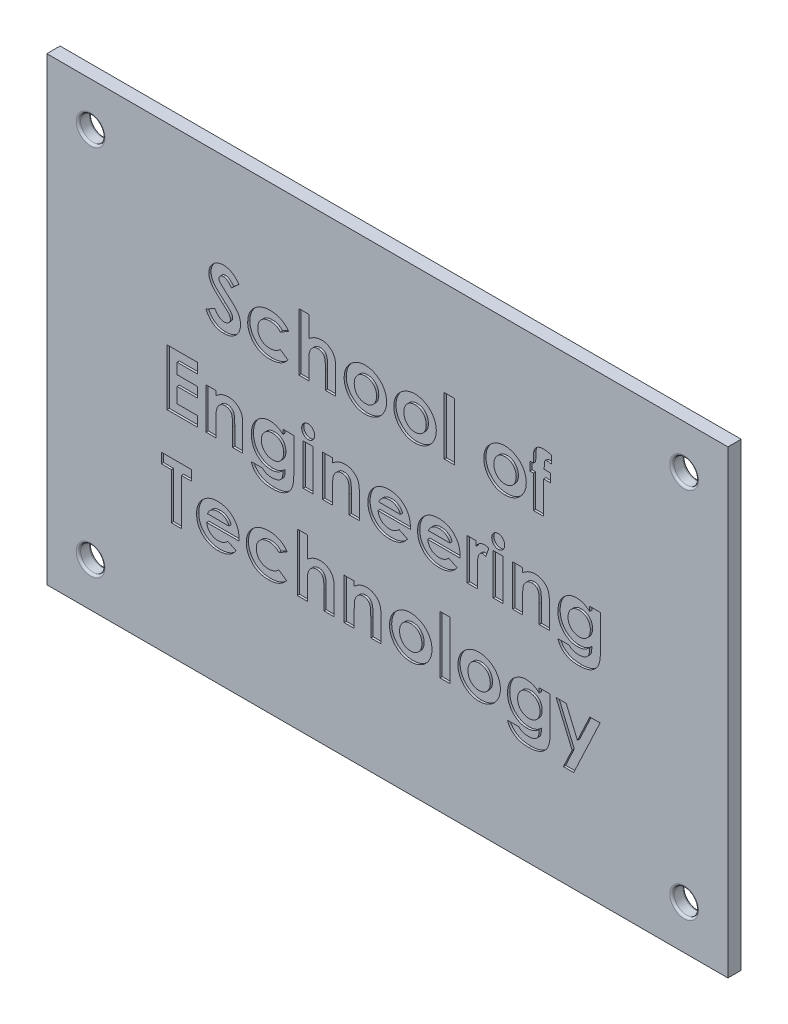
from build123d import *

# Parameters (mm, degrees)
SKETCH1_W           = 154.05
SKETCH1_H           = 104.04
BOSS_EXTRUDE1_DEPTH = 3
SKETCH2_R           = 2.75
CUT_EXTRUDE1_DEPTH  = 93.994252645
SKETCH3_W           = 2.279487179
SKETCH3_H           = 13.025641025
SKETCH3_H_2         = 9.280769231
SKETCH3_H_3         = 13.025641026
CUT_EXTRUDE2_DEPTH  = 0.5
FILLET1_R           = 0.5


with BuildPart() as part:
    # Sketch1 → Boss-Extrude1 (new body)
    with BuildSketch(Plane.XY):
        Rectangle(SKETCH1_W, SKETCH1_H)
    extrude(amount=BOSS_EXTRUDE1_DEPTH)

    # Sketch2 → Cut-Extrude1 (cut, through all)
    with BuildSketch(Plane.XY.offset(3)):
        with Locations((-67.125, 42.12)):
            Circle(SKETCH2_R)
        with Locations((67.125, 42.12)):
            Circle(SKETCH2_R)
        with Locations((67.125, -42.12)):
            Circle(SKETCH2_R)
        with Locations((-67.125, -42.12)):
            Circle(SKETCH2_R)
    extrude(amount=-CUT_EXTRUDE1_DEPTH, mode=Mode.SUBTRACT)

    # Sketch3 → Cut-Extrude2 (cut)
    # profile 1 of 31: a face of its own
    with BuildSketch(Plane.XY.offset(3)):
        with BuildLine():
            Line((-33.546322387, 28.565813912), (-35.250849631, 27.006298687))
            add(Edge.make_bspline(
                [(-35.250849631, 27.006298687), (-35.323864269, 27.109293425), (-35.464042192, 27.307028959), (-35.691255985, 27.571801499), (-35.917443791, 27.79767218), (-36.144701102, 27.983697419), (-36.375042242, 28.128746973), (-36.608067371, 28.231443659), (-36.842455405, 28.296728917), (-36.999927982, 28.304858503), (-37.077492259, 28.30886279)],
                knots=[0, 0, 0, 0, 1.299362458, 2.494594718, 3.587462134, 4.587049575, 5.512617175, 6.380583204, 7.202344345, 8, 8, 8, 8], degree=3))
            add(Edge.make_bspline(
                [(-37.077492259, 28.30886279), (-37.149841991, 28.30632549), (-37.289530316, 28.30142663), (-37.488666385, 28.25273233), (-37.665462224, 28.16869312), (-37.819745287, 28.058804782), (-37.941960235, 27.926414812), (-38.039539394, 27.787571773), (-38.094484659, 27.634320458), (-38.101716537, 27.529061273), (-38.105296746, 27.476951732)],
                knots=[0, 0, 0, 0, 1.185010067, 2.2879431, 3.333075148, 4.379039566, 5.372662701, 6.27520591, 7.14612461, 8, 8, 8, 8], degree=3))
            add(Edge.make_bspline(
                [(-38.105296746, 27.476951732), (-38.103053211, 27.424090749), (-38.098535043, 27.317636074), (-38.054895688, 27.161613491), (-37.989118719, 27.009161265), (-37.92626614, 26.91635634), (-37.894138893, 26.86891888)],
                knots=[0, 0, 0, 0, 0.967525499, 1.948461899, 2.951351359, 4, 4, 4, 4], degree=3))
            add(Edge.make_bspline(
                [(-37.894138893, 26.86891888), (-37.864931751, 26.832046238), (-37.797700765, 26.747170286), (-37.669505045, 26.612740009), (-37.508518144, 26.448051153), (-37.308544947, 26.258766884), (-37.077886891, 26.038079801), (-36.805852679, 25.794665197), (-36.50027264, 25.520984804), (-36.283073427, 25.330403689), (-36.169259086, 25.230537469)],
                knots=[0, 0, 0, 0, 0.473873513, 1.090794244, 1.870441696, 2.795289791, 3.865433203, 5.087734844, 6.473946851, 8, 8, 8, 8], degree=3))
            add(Edge.make_bspline(
                [(-36.169259086, 25.230537469), (-36.062427954, 25.138080513), (-35.859684661, 24.96261642), (-35.571221216, 24.713573311), (-35.317709891, 24.489515299), (-35.095457605, 24.293805014), (-34.907833485, 24.124389008), (-34.754048758, 23.980457474), (-34.632225206, 23.864812495), (-34.56297565, 23.794962857), (-34.533421746, 23.765152854)],
                knots=[0, 0, 0, 0, 1.543621617, 2.929473131, 4.163658386, 5.240097082, 6.164993805, 6.925417477, 7.541396219, 8, 8, 8, 8], degree=3))
            add(Edge.make_bspline(
                [(-34.533421746, 23.765152854), (-34.421300397, 23.643813541), (-34.205763788, 23.410556769), (-33.925642178, 23.04908213), (-33.695093032, 22.696209177), (-33.516735841, 22.345298032), (-33.382033317, 21.991285745), (-33.287066253, 21.625490185), (-33.230189846, 21.244089017), (-33.223875237, 20.98382928), (-33.220681361, 20.852192117)],
                knots=[0, 0, 0, 0, 1.206664779, 2.319633467, 3.337109185, 4.282041471, 5.190008762, 6.099243693, 7.03861361, 8, 8, 8, 8], degree=3))
            add(Edge.make_bspline(
                [(-33.220681361, 20.852192117), (-33.22295468, 20.723927845), (-33.227415017, 20.472268569), (-33.282045582, 20.104002705), (-33.359945562, 19.751556291), (-33.480392597, 19.418764441), (-33.62719273, 19.100164479), (-33.811227899, 18.800719178), (-34.02735197, 18.517398031), (-34.275063339, 18.255265749), (-34.549061528, 18.017398872), (-34.842950626, 17.80564416), (-35.159604429, 17.630813673), (-35.496317496, 17.486853237), (-35.852909592, 17.375972984), (-36.228955909, 17.294022143), (-36.625031636, 17.244836541), (-36.895873925, 17.239694769), (-37.03424306, 17.237067918)],
                knots=[0, 0, 0, 0, 1.043214005, 2.046824704, 3.02475056, 3.976699089, 4.921714032, 5.875962561, 6.831408892, 7.817874052, 8.806269674, 9.781291748, 10.760897367, 11.74438705, 12.757449933, 13.795994037, 14.874007457, 16, 16, 16, 16], degree=3))
            add(Edge.make_bspline(
                [(-37.03424306, 17.237067918), (-37.142861653, 17.238994884), (-37.357988759, 17.242811382), (-37.675053589, 17.273969913), (-37.981215526, 17.324256467), (-38.276129703, 17.39633212), (-38.561124763, 17.487661749), (-38.836212409, 17.599217391), (-39.09949362, 17.732728118), (-39.352960506, 17.885448418), (-39.595380906, 18.062776804), (-39.82982013, 18.261087854), (-40.053949505, 18.483431681), (-40.268845479, 18.729282451), (-40.473133088, 18.999336354), (-40.673499398, 19.289832389), (-40.861039528, 19.606161769), (-40.976891408, 19.828069387), (-41.036065977, 19.941414873)],
                knots=[0, 0, 0, 0, 1.016823716, 2.013894106, 2.979844003, 3.91962641, 4.853723003, 5.779685073, 6.695824784, 7.614987388, 8.547259901, 9.504950863, 10.487499108, 11.500346958, 12.559593716, 13.656357062, 14.802919212, 16, 16, 16, 16], degree=3))
            Line((-41.036065977, 19.941414873), (-39.031338413, 21.144760226))
            add(Edge.make_bspline(
                [(-39.031338413, 21.144760226), (-38.957319871, 21.01609829), (-38.815420001, 20.769442363), (-38.574957406, 20.438028863), (-38.328615753, 20.15422806), (-38.070699844, 19.92305615), (-37.80434584, 19.741422068), (-37.528267189, 19.611613752), (-37.242269924, 19.531262552), (-37.04746158, 19.521449814), (-36.950288733, 19.516555097)],
                knots=[0, 0, 0, 0, 1.283663364, 2.460892379, 3.537111102, 4.529833553, 5.449777664, 6.316464042, 7.160231139, 8, 8, 8, 8], degree=3))
            add(Edge.make_bspline(
                [(-36.950288733, 19.516555097), (-36.851450036, 19.520552388), (-36.659688569, 19.528307715), (-36.385973614, 19.599941329), (-36.135021379, 19.712411358), (-35.918100121, 19.87289058), (-35.734424876, 20.058107993), (-35.598862002, 20.264170834), (-35.513700491, 20.487125854), (-35.504696854, 20.642005076), (-35.500168541, 20.71990045)],
                knots=[0, 0, 0, 0, 1.13588714, 2.203786484, 3.234766741, 4.283437687, 5.291419208, 6.222934724, 7.106237994, 8, 8, 8, 8], degree=3))
            add(Edge.make_bspline(
                [(-35.500168541, 20.71990045), (-35.504350253, 20.79236942), (-35.512845, 20.939583194), (-35.575414692, 21.158466404), (-35.673230205, 21.37725007), (-35.788952854, 21.556702353), (-35.90671514, 21.706952884), (-36.019322447, 21.837138173), (-36.156448359, 21.980970126), (-36.317745185, 22.138629672), (-36.501081772, 22.31150473), (-36.706612559, 22.499578369), (-36.936691089, 22.701193887), (-37.099311049, 22.838532385), (-37.18434322, 22.910345162)],
                knots=[0, 0, 0, 0, 0.916159276, 1.861089862, 2.860218735, 3.940849679, 4.552606315, 5.27541173, 6.11797699, 7.06649574, 8.129236253, 9.306560635, 10.591630461, 12, 12, 12, 12], degree=3))
            add(Edge.make_bspline(
                [(-37.18434322, 22.910345162), (-37.345992762, 23.047116175), (-37.656247161, 23.309621148), (-38.09467599, 23.697332728), (-38.48973962, 24.059684726), (-38.83802586, 24.401156604), (-39.143972413, 24.715442167), (-39.405507277, 25.005094164), (-39.619757373, 25.272346863), (-39.845209401, 25.588889801), (-40.059433904, 25.97461912), (-40.244584666, 26.438696208), (-40.364702666, 26.902714412), (-40.378160217, 27.214230676), (-40.384783926, 27.3675567)],
                knots=[0, 0, 0, 0, 1.345494975, 2.582412109, 3.71882943, 4.751509156, 5.681369928, 6.505683931, 7.230279997, 7.856715994, 8.973648664, 10.023341002, 11.027102913, 12, 12, 12, 12], degree=3))
            add(Edge.make_bspline(
                [(-40.384783926, 27.3675567), (-40.382029134, 27.476287287), (-40.376601899, 27.690498223), (-40.328190126, 28.005464193), (-40.255836886, 28.309379889), (-40.15075921, 28.601136489), (-40.014381074, 28.880368556), (-39.848755125, 29.148443048), (-39.651309506, 29.402892668), (-39.428801623, 29.643548735), (-39.183654904, 29.863480993), (-38.921684482, 30.057593248), (-38.644373131, 30.221543281), (-38.353417303, 30.357551738), (-38.047014064, 30.461657572), (-37.727420675, 30.535452976), (-37.394178735, 30.57934413), (-37.167514762, 30.585310623), (-37.052051554, 30.588349969)],
                knots=[0, 0, 0, 0, 1.010766082, 1.991317756, 2.957454644, 3.913069143, 4.869106762, 5.843196583, 6.838735724, 7.860187025, 8.887984031, 9.89767229, 10.887916223, 11.879572884, 12.879850636, 13.892031539, 14.926195476, 16, 16, 16, 16], degree=3))
            add(Edge.make_bspline(
                [(-37.052051554, 30.588349969), (-36.902416951, 30.582876017), (-36.604328909, 30.571971321), (-36.163597141, 30.486700164), (-35.733108777, 30.352602288), (-35.386213186, 30.190827954), (-35.110194839, 30.03411708), (-34.89865256, 29.889837448), (-34.683396904, 29.724557374), (-34.462691969, 29.537756019), (-34.240638793, 29.325913798), (-34.010923343, 29.094073783), (-33.776675773, 28.840232335), (-33.624451993, 28.658889181), (-33.546322387, 28.565813912)],
                knots=[0, 0, 0, 0, 1.282922637, 2.555718331, 3.837320111, 5.142675274, 5.830281639, 6.55870424, 7.337177975, 8.157850921, 9.037902056, 9.96903443, 10.957596896, 12, 12, 12, 12], degree=3))
        make_face()
    # profile 2 of 31: a face of its own
    with BuildSketch(Plane.XY.offset(3)):
        with BuildLine():
            Line((-22.311707002, 24.950689713), (-24.199407323, 23.912708944))
            add(Edge.make_bspline(
                [(-24.199407323, 23.912708944), (-24.285932626, 23.999356411), (-24.452256011, 24.165914627), (-24.718968926, 24.376750904), (-24.980916031, 24.551317476), (-25.248896322, 24.68013864), (-25.525305225, 24.777153323), (-25.820112471, 24.841408279), (-26.136758982, 24.883717885), (-26.355783734, 24.887619997), (-26.46871822, 24.889632021)],
                knots=[0, 0, 0, 0, 1.150764855, 2.212059359, 3.192108068, 4.105322427, 5.000809612, 5.941206042, 6.938435785, 8, 8, 8, 8], degree=3))
            add(Edge.make_bspline(
                [(-26.46871822, 24.889632021), (-26.572286939, 24.887130454), (-26.774962236, 24.882235098), (-27.071103007, 24.845670142), (-27.352554464, 24.78824054), (-27.618811385, 24.704220831), (-27.869399541, 24.593226223), (-28.106391188, 24.4618808), (-28.327483389, 24.305054387), (-28.529550947, 24.124976233), (-28.711952435, 23.926714175), (-28.874663868, 23.715259171), (-29.007962957, 23.487474335), (-29.123208286, 23.248713436), (-29.207938058, 22.99449201), (-29.26992842, 22.727116853), (-29.30526235, 22.446576119), (-29.310381612, 22.25491887), (-29.312989054, 22.15730029)],
                knots=[0, 0, 0, 0, 1.121765476, 2.195200973, 3.227634963, 4.230038321, 5.213228299, 6.192116585, 7.160777141, 8.14345191, 9.118668839, 10.075979138, 11.027630062, 11.972829041, 12.943187208, 13.923755399, 14.94248691, 16, 16, 16, 16], degree=3))
            add(Edge.make_bspline(
                [(-29.312989054, 22.15730029), (-29.310234067, 22.062229233), (-29.30485476, 21.87659626), (-29.271806111, 21.603857185), (-29.214432412, 21.344221225), (-29.128408061, 21.099060997), (-29.025298258, 20.866116474), (-28.895811222, 20.647240309), (-28.743541602, 20.441476724), (-28.567687759, 20.250614106), (-28.372886326, 20.078956599), (-28.162875108, 19.927365248), (-27.93828069, 19.798843828), (-27.696486773, 19.697983397), (-27.441435562, 19.615803246), (-27.171423818, 19.557287762), (-26.886738875, 19.52480762), (-26.692676358, 19.519348461), (-26.593377676, 19.516555097)],
                knots=[0, 0, 0, 0, 1.070556293, 2.090336998, 3.088792742, 4.058148387, 5.011235098, 5.952916408, 6.915475435, 7.888633318, 8.869583867, 9.83422472, 10.800707077, 11.776204622, 12.778807041, 13.814557445, 14.881744048, 16, 16, 16, 16], degree=3))
            add(Edge.make_bspline(
                [(-26.593377676, 19.516555097), (-26.471117198, 19.519352775), (-26.232482513, 19.524813434), (-25.885576934, 19.571128992), (-25.559143532, 19.647718638), (-25.253147687, 19.753724791), (-24.968017495, 19.892329811), (-24.704485577, 20.061625504), (-24.459842831, 20.260362998), (-24.31718066, 20.415303225), (-24.245200592, 20.493478174)],
                knots=[0, 0, 0, 0, 1.116373375, 2.178998604, 3.189797796, 4.174590301, 5.13072713, 6.078291395, 7.030403691, 8, 8, 8, 8], degree=3))
            Line((-24.245200592, 20.493478174), (-22.474527515, 19.277412469))
            add(Edge.make_bspline(
                [(-22.474527515, 19.277412469), (-22.597262068, 19.127353958), (-22.839469376, 18.831224897), (-23.262053962, 18.449525347), (-23.716882617, 18.12156062), (-24.213102924, 17.859783331), (-24.743488278, 17.651572963), (-25.312183129, 17.504388904), (-25.918225571, 17.417747919), (-26.334444857, 17.40593675), (-26.547584406, 17.399888431)],
                knots=[0, 0, 0, 0, 0.997876357, 1.969233105, 2.924898516, 3.881013542, 4.852507933, 5.855329832, 6.901747111, 8, 8, 8, 8], degree=3))
            add(Edge.make_bspline(
                [(-26.547584406, 17.399888431), (-26.739423219, 17.404323175), (-27.114105574, 17.41298472), (-27.660195797, 17.479315806), (-28.173822009, 17.591041493), (-28.656040816, 17.74620551), (-29.106412576, 17.947201013), (-29.523476693, 18.196510537), (-29.910046257, 18.4871992), (-30.259146, 18.820640203), (-30.570623073, 19.183594336), (-30.84254368, 19.565842744), (-31.077713059, 19.960536651), (-31.262203208, 20.374245586), (-31.412982506, 20.800521191), (-31.514814112, 21.244458985), (-31.581978327, 21.702402193), (-31.588948766, 22.012893249), (-31.592476233, 22.170020642)],
                knots=[0, 0, 0, 0, 1.183377041, 2.311265848, 3.387807024, 4.421911742, 5.431260577, 6.423665966, 7.413571885, 8.409103097, 9.395976332, 10.359992013, 11.300391101, 12.225292883, 13.150239058, 14.085544813, 15.031169026, 16, 16, 16, 16], degree=3))
            add(Edge.make_bspline(
                [(-31.592476233, 22.170020642), (-31.590586543, 22.27949263), (-31.586843649, 22.496322976), (-31.55489117, 22.818340222), (-31.505183848, 23.134892964), (-31.430479613, 23.443759167), (-31.33860659, 23.746437339), (-31.226922491, 24.042866635), (-31.091022081, 24.331517432), (-30.939424763, 24.614845165), (-30.766646039, 24.885370401), (-30.578148035, 25.142973743), (-30.374196328, 25.386077488), (-30.152395001, 25.612415979), (-29.914290594, 25.823608754), (-29.663344529, 26.023940526), (-29.39143631, 26.203079724), (-29.10801852, 26.371503659), (-28.810649805, 26.521433401), (-28.502748013, 26.650842534), (-28.186692538, 26.760794256), (-27.861725809, 26.84919766), (-27.52924265, 26.922058272), (-27.186284548, 26.968298611), (-26.835688904, 27.000799953), (-26.598542998, 27.004454725), (-26.478894502, 27.006298687)],
                knots=[0, 0, 0, 0, 1.00272354, 1.986087015, 2.96193297, 3.936200312, 4.894695956, 5.858592327, 6.835334787, 7.815655071, 8.800643866, 9.773423113, 10.738352213, 11.705312252, 12.673769326, 13.65298065, 14.64420052, 15.654211674, 16.672258995, 17.692438602, 18.712115155, 19.735602823, 20.776372304, 21.827874031, 22.90408564, 24, 24, 24, 24], degree=3))
            add(Edge.make_bspline(
                [(-26.478894502, 27.006298687), (-26.367756401, 27.005042176), (-26.148568564, 27.002564072), (-25.824877676, 26.97665204), (-25.510016417, 26.932639315), (-25.203448952, 26.874412334), (-24.904244241, 26.802258965), (-24.61641242, 26.706080941), (-24.336018343, 26.596922505), (-23.97486781, 26.432104665), (-23.549137431, 26.186087362), (-23.081799536, 25.833244316), (-22.665111227, 25.420469414), (-22.430134538, 25.108115257), (-22.311707002, 24.950689713)],
                knots=[0, 0, 0, 0, 0.826738014, 1.630502179, 2.413926014, 3.191023582, 3.95155221, 4.701751672, 5.446919844, 6.189438973, 7.653650558, 9.094719814, 10.535747635, 12, 12, 12, 12], degree=3))
        make_face()
    # profile 3 of 31: a face of its own
    with BuildSketch(Plane.XY.offset(3)):
        with BuildLine():
            Line((-20.032219823, 30.588349969), (-17.752732643, 30.588349969))
            Line((-17.752732643, 30.588349969), (-17.752732643, 25.838570322))
            add(Edge.make_bspline(
                [(-17.752732643, 25.838570322), (-17.637910043, 25.931950843), (-17.414100898, 26.11396566), (-17.062937011, 26.351087778), (-16.712499464, 26.553434513), (-16.359069598, 26.717422708), (-16.004180719, 26.845930654), (-15.647219993, 26.937066343), (-15.287843779, 26.996859399), (-15.046923336, 27.003148902), (-14.926270304, 27.006298687)],
                knots=[0, 0, 0, 0, 1.13710654, 2.216417683, 3.252896077, 4.244436563, 5.207303112, 6.149540546, 7.073289332, 8, 8, 8, 8], degree=3))
            add(Edge.make_bspline(
                [(-14.926270304, 27.006298687), (-14.81081345, 27.003235135), (-14.584161949, 26.997221124), (-14.251650457, 26.953781072), (-13.933170851, 26.879031943), (-13.627938571, 26.776276306), (-13.338053556, 26.638085111), (-13.059746175, 26.476211575), (-12.796324483, 26.282271938), (-12.636047388, 26.132773806), (-12.555196586, 26.057360386)],
                knots=[0, 0, 0, 0, 1.056403236, 2.073808271, 3.062028718, 4.046096703, 5.014652014, 5.995532726, 6.988858718, 8, 8, 8, 8], degree=3))
            add(Edge.make_bspline(
                [(-12.555196586, 26.057360386), (-12.488796734, 25.986893452), (-12.355033635, 25.844937178), (-12.188435265, 25.600207841), (-12.044579237, 25.333636864), (-11.927357082, 25.0427193), (-11.840177163, 24.727319729), (-11.772682228, 24.390036459), (-11.735356093, 24.027186741), (-11.730749532, 23.777106207), (-11.728373669, 23.64812561)],
                knots=[0, 0, 0, 0, 0.887296576, 1.787466942, 2.706642908, 3.663267187, 4.658426068, 5.705361056, 6.816525637, 8, 8, 8, 8], degree=3))
            Line((-11.728373669, 23.64812561), (-11.728373669, 17.562708944))
            Line((-11.728373669, 17.562708944), (-14.007860849, 17.562708944))
            Line((-14.007860849, 17.562708944), (-14.007860849, 21.597604777))
            add(Edge.make_bspline(
                [(-14.007860849, 21.597604777), (-14.008303758, 21.72566019), (-14.009151532, 21.97077146), (-14.016764559, 22.322757679), (-14.029196871, 22.642523703), (-14.046198625, 22.930166166), (-14.069936788, 23.184482962), (-14.09328494, 23.407296937), (-14.126047868, 23.597540063), (-14.1751062, 23.8042573), (-14.254944297, 24.025358067), (-14.370962047, 24.261041981), (-14.525929883, 24.455553648), (-14.705266831, 24.615977007), (-14.912622261, 24.738418184), (-15.140573054, 24.828851111), (-15.393016154, 24.879708353), (-15.567998351, 24.886237732), (-15.658962611, 24.889632021)],
                knots=[0, 0, 0, 0, 1.461461505, 2.797388094, 4.017818807, 5.113567707, 6.085313608, 6.932873269, 7.669572396, 8.286941306, 9.355291607, 10.346554054, 11.270113241, 12.175128673, 13.078071705, 14.003657132, 14.962203834, 16, 16, 16, 16], degree=3))
            add(Edge.make_bspline(
                [(-15.658962611, 24.889632021), (-15.777462094, 24.884999486), (-16.009556689, 24.875926144), (-16.342390605, 24.782526937), (-16.649386107, 24.634897635), (-16.926960269, 24.430290066), (-17.168836696, 24.174010937), (-17.371491814, 23.873626205), (-17.537252606, 23.532140367), (-17.608897404, 23.283122989), (-17.645881682, 23.154575931)],
                knots=[0, 0, 0, 0, 0.993549393, 1.945978497, 2.879753144, 3.843180486, 4.826017097, 5.826060929, 6.877775219, 8, 8, 8, 8], degree=3))
            add(Edge.make_bspline(
                [(-17.645881682, 23.154575931), (-17.655090846, 23.114843905), (-17.676090754, 23.024241886), (-17.692172881, 22.869659278), (-17.716038502, 22.682795394), (-17.724317103, 22.462530445), (-17.739824884, 22.209204167), (-17.745402092, 21.922406694), (-17.751016924, 21.601868397), (-17.752142353, 21.377123072), (-17.752732643, 21.259243399)],
                knots=[0, 0, 0, 0, 0.514379255, 1.17295301, 1.959069106, 2.891908278, 3.953016936, 5.163065833, 6.51201855, 8, 8, 8, 8], degree=3))
            Line((-17.752732643, 21.259243399), (-17.752732643, 17.562708944))
            Line((-17.752732643, 17.562708944), (-20.032219823, 17.562708944))
            Line((-20.032219823, 17.562708944), (-20.032219823, 30.588349969))
        make_face()
    # profile 4 of 31: a face of its own
    with BuildSketch(Plane.XY.offset(3)):
        with BuildLine():
            add(Edge.make_bspline(
                [(-5.027291938, 27.006298687), (-4.919522185, 27.004380851), (-4.706089241, 27.000582665), (-4.388207533, 26.968966241), (-4.075883131, 26.917382742), (-3.767320835, 26.850591114), (-3.465385934, 26.757006054), (-3.168494817, 26.644765245), (-2.873992899, 26.51589967), (-2.58918966, 26.362504562), (-2.312027609, 26.196133578), (-2.049261489, 26.012612731), (-1.803073393, 25.813383516), (-1.568893231, 25.603065219), (-1.357634176, 25.372501267), (-1.155795642, 25.132801198), (-0.974282473, 24.875377397), (-0.806227425, 24.606502684), (-0.656609225, 24.327731911), (-0.526693334, 24.041004305), (-0.413938556, 23.750284079), (-0.325653824, 23.452030062), (-0.252562203, 23.150175128), (-0.206436195, 22.841020273), (-0.173643802, 22.527741291), (-0.169966735, 22.316816101), (-0.168117259, 22.210725771)],
                knots=[0, 0, 0, 0, 1.022364134, 2.024744242, 3.027414945, 4.024939316, 5.017584196, 6.023349371, 7.035562955, 8.064994934, 9.090267829, 10.101425541, 11.102933353, 12.093946398, 13.084502048, 14.067315274, 15.065326281, 16.070028806, 17.074376865, 18.064572984, 19.055292013, 20.030201733, 21.013838017, 21.999348303, 22.993720005, 24, 24, 24, 24], degree=3))
            add(Edge.make_bspline(
                [(-0.168117259, 22.210725771), (-0.170069075, 22.103806609), (-0.173949728, 21.89122708), (-0.205249807, 21.575001322), (-0.257030751, 21.264392655), (-0.324078728, 20.95757123), (-0.417313567, 20.658463119), (-0.526248524, 20.362659352), (-0.659970469, 20.074191845), (-0.807809933, 19.789913689), (-0.976945504, 19.518190322), (-1.158301553, 19.258187755), (-1.359294688, 19.016727076), (-1.568862555, 18.786319919), (-1.796945433, 18.574757623), (-2.039902692, 18.378604978), (-2.295630998, 18.195463933), (-2.565969307, 18.029631321), (-2.847455037, 17.883920118), (-3.135340984, 17.752549578), (-3.431310543, 17.643174223), (-3.734751192, 17.553981633), (-4.045846955, 17.484922043), (-4.363911015, 17.438009042), (-4.688258378, 17.405381591), (-4.90679086, 17.401731272), (-5.017115656, 17.399888431)],
                knots=[0, 0, 0, 0, 1.012026251, 2.012137606, 3.004615893, 3.992048833, 4.982446996, 5.968083444, 6.973977695, 7.990229942, 8.999482246, 10.001782172, 10.988562221, 11.971415814, 12.948383116, 13.930088534, 14.925840678, 15.924049238, 16.929462851, 17.924729459, 18.917889337, 19.913673841, 20.916777188, 21.931792057, 22.95587778, 24, 24, 24, 24], degree=3))
            add(Edge.make_bspline(
                [(-5.017115656, 17.399888431), (-5.178433005, 17.404623413), (-5.496391956, 17.413956135), (-5.964670317, 17.477882841), (-6.414531241, 17.587917461), (-6.84670777, 17.741303295), (-7.261761312, 17.937861526), (-7.656069613, 18.181132186), (-8.033554965, 18.466325972), (-8.387679036, 18.791032402), (-8.712104658, 19.147264758), (-8.995529473, 19.527540628), (-9.236180076, 19.926160315), (-9.433839956, 20.343578381), (-9.586393076, 20.780367217), (-9.696562458, 21.235220979), (-9.760567321, 21.709418193), (-9.76982111, 22.03160146), (-9.774527515, 22.195461347)],
                knots=[0, 0, 0, 0, 1.029999031, 2.030143771, 3.011211297, 3.982305373, 4.953580601, 5.938004764, 6.935448627, 7.970290061, 9.001484052, 10.007591832, 10.993831261, 11.969999897, 12.951306496, 13.942897864, 14.953773953, 16, 16, 16, 16], degree=3))
            add(Edge.make_bspline(
                [(-9.774527515, 22.195461347), (-9.769656984, 22.370427788), (-9.760084052, 22.714320823), (-9.684070761, 23.218131956), (-9.562685734, 23.700507239), (-9.388445175, 24.160097316), (-9.165868185, 24.597749838), (-8.894152124, 25.012541748), (-8.571954153, 25.404567002), (-8.325215025, 25.641677314), (-8.199747868, 25.762248206)],
                knots=[0, 0, 0, 0, 1.043912699, 2.05178951, 3.033892, 4.007821512, 4.978932272, 5.95884105, 6.962068106, 8, 8, 8, 8], degree=3))
            add(Edge.make_bspline(
                [(-8.199747868, 25.762248206), (-8.08461921, 25.862187914), (-7.857494201, 26.059348269), (-7.488490813, 26.309413856), (-7.110672983, 26.525394231), (-6.719512401, 26.702970271), (-6.313918612, 26.83685974), (-5.895970055, 26.934319294), (-5.465753636, 26.994181808), (-5.174188574, 27.002239202), (-5.027291938, 27.006298687)],
                knots=[0, 0, 0, 0, 1.048115528, 2.067714963, 3.060638214, 4.039924844, 5.017819947, 5.994373833, 6.98952318, 8, 8, 8, 8], degree=3))
        make_face()
        with BuildLine():
            add(Edge.make_bspline(
                [(-4.976410528, 24.889632021), (-5.064666016, 24.8866987), (-5.238397895, 24.880924428), (-5.494135784, 24.849935451), (-5.736015374, 24.786420882), (-5.968840842, 24.705647733), (-6.188493484, 24.597625027), (-6.400988803, 24.471213567), (-6.595277509, 24.31302518), (-6.780761856, 24.139504093), (-6.949140298, 23.946813582), (-7.09261472, 23.736877414), (-7.220812294, 23.517727308), (-7.318018014, 23.281339905), (-7.398465039, 23.034176358), (-7.452910621, 22.772243256), (-7.490800945, 22.498466536), (-7.493613764, 22.310927605), (-7.495040336, 22.215813912)],
                knots=[0, 0, 0, 0, 1.030650113, 2.02884584, 2.99876339, 3.944280128, 4.900564847, 5.851248946, 6.823638398, 7.81794922, 8.81432732, 9.802856497, 10.78262424, 11.771747962, 12.779760563, 13.812642396, 14.89064281, 16, 16, 16, 16], degree=3))
            add(Edge.make_bspline(
                [(-7.495040336, 22.215813912), (-7.493371053, 22.11734603), (-7.490108761, 21.924909467), (-7.456327044, 21.643926206), (-7.400619879, 21.377274953), (-7.321477457, 21.125367628), (-7.221942497, 20.886396071), (-7.099824643, 20.661701073), (-6.953835079, 20.452633639), (-6.788318347, 20.25945122), (-6.607084595, 20.0840974), (-6.408502818, 19.933615313), (-6.200888873, 19.802866352), (-5.979458208, 19.697854756), (-5.747355773, 19.616777284), (-5.503892552, 19.557082668), (-5.247789146, 19.524922103), (-5.073167096, 19.51938245), (-4.98404274, 19.516555097)],
                knots=[0, 0, 0, 0, 1.141730614, 2.231293227, 3.276944405, 4.297399982, 5.28939179, 6.275415646, 7.257752684, 8.24146775, 9.222424823, 10.176631434, 11.126518621, 12.063689483, 13.012557477, 13.974037417, 14.965980454, 16, 16, 16, 16], degree=3))
            add(Edge.make_bspline(
                [(-4.98404274, 19.516555097), (-4.894873807, 19.519062831), (-4.720050936, 19.523979445), (-4.463646784, 19.560797118), (-4.218940261, 19.618740878), (-3.98485549, 19.700516157), (-3.763285068, 19.80777547), (-3.553380803, 19.939149951), (-3.353296143, 20.091725108), (-3.169630216, 20.270387522), (-2.99961418, 20.464172408), (-2.850520285, 20.674343494), (-2.725931804, 20.899038549), (-2.623746941, 21.13684379), (-2.544449372, 21.387432355), (-2.48966445, 21.65173565), (-2.451753868, 21.92893458), (-2.449004664, 22.119006479), (-2.447604438, 22.215813912)],
                knots=[0, 0, 0, 0, 1.031504075, 2.022346795, 2.991027682, 3.937587355, 4.885570121, 5.833146507, 6.798790848, 7.791235734, 8.792807298, 9.778388351, 10.766749885, 11.760164525, 12.768777521, 13.802286646, 14.880660483, 16, 16, 16, 16], degree=3))
            add(Edge.make_bspline(
                [(-2.447604438, 22.215813912), (-2.449294956, 22.31258751), (-2.4526123, 22.502488703), (-2.486396425, 22.780062539), (-2.541556895, 23.043511532), (-2.621720081, 23.291710775), (-2.720663419, 23.527491829), (-2.84286568, 23.749647818), (-2.989575218, 23.957084567), (-3.155896573, 24.148773489), (-3.339847132, 24.321666697), (-3.534981051, 24.475845466), (-3.745760442, 24.603363154), (-3.968230956, 24.708483249), (-4.202984483, 24.789358156), (-4.449757472, 24.849391077), (-4.709306206, 24.881094011), (-4.886445233, 24.886756273), (-4.976410528, 24.889632021)],
                knots=[0, 0, 0, 0, 1.123894411, 2.205445421, 3.243160173, 4.246488011, 5.231014757, 6.210004299, 7.185865357, 8.177612767, 9.153374344, 10.115157457, 11.061423229, 12.009021698, 12.96873347, 13.94135618, 14.954456845, 16, 16, 16, 16], degree=3))
        make_face(mode=Mode.SUBTRACT)
    # profile 5 of 31: a face of its own
    with BuildSketch(Plane.XY.offset(3)):
        with BuildLine():
            add(Edge.make_bspline(
                [(6.207323446, 27.006298687), (6.3150932, 27.004380851), (6.528526144, 27.000582665), (6.846407851, 26.968966241), (7.158732254, 26.917382742), (7.46729455, 26.850591114), (7.769229451, 26.757006054), (8.066120568, 26.644765245), (8.360622485, 26.51589967), (8.645425724, 26.362504562), (8.922587776, 26.196133578), (9.185353895, 26.012612731), (9.431541992, 25.813383516), (9.665722154, 25.603065219), (9.876981208, 25.372501267), (10.078819742, 25.132801198), (10.260332912, 24.875377397), (10.42838796, 24.606502684), (10.57800616, 24.327731911), (10.707922051, 24.041004305), (10.820676829, 23.750284079), (10.908961561, 23.452030062), (10.982053182, 23.150175128), (11.028179189, 22.841020273), (11.060971583, 22.527741291), (11.064648649, 22.316816101), (11.066498126, 22.210725771)],
                knots=[0, 0, 0, 0, 1.022364134, 2.024744242, 3.027414945, 4.024939316, 5.017584196, 6.023349371, 7.035562955, 8.064994934, 9.090267829, 10.101425541, 11.102933353, 12.093946398, 13.084502048, 14.067315274, 15.065326281, 16.070028806, 17.074376865, 18.064572984, 19.055292013, 20.030201733, 21.013838017, 21.999348303, 22.993720005, 24, 24, 24, 24], degree=3))
            add(Edge.make_bspline(
                [(11.066498126, 22.210725771), (11.06454631, 22.103806609), (11.060665657, 21.89122708), (11.029365578, 21.575001322), (10.977584633, 21.264392655), (10.910536656, 20.95757123), (10.817301818, 20.658463119), (10.708366861, 20.362659352), (10.574644916, 20.074191845), (10.426805452, 19.789913689), (10.257669881, 19.518190322), (10.076313832, 19.258187755), (9.875320697, 19.016727076), (9.66575283, 18.786319919), (9.437669952, 18.574757623), (9.194712692, 18.378604978), (8.938984386, 18.195463933), (8.668646077, 18.029631321), (8.387160347, 17.883920118), (8.099274401, 17.752549578), (7.803304841, 17.643174223), (7.499864193, 17.553981633), (7.188768429, 17.484922043), (6.87070437, 17.438009042), (6.546357006, 17.405381591), (6.327824525, 17.401731272), (6.217499728, 17.399888431)],
                knots=[0, 0, 0, 0, 1.012026251, 2.012137606, 3.004615893, 3.992048833, 4.982446996, 5.968083444, 6.973977695, 7.990229942, 8.999482246, 10.001782172, 10.988562221, 11.971415814, 12.948383116, 13.930088534, 14.925840678, 15.924049238, 16.929462851, 17.924729459, 18.917889337, 19.913673841, 20.916777188, 21.931792057, 22.95587778, 24, 24, 24, 24], degree=3))
            add(Edge.make_bspline(
                [(6.217499728, 17.399888431), (6.056182379, 17.404623413), (5.738223429, 17.413956135), (5.269945068, 17.477882841), (4.820084144, 17.587917461), (4.387907615, 17.741303295), (3.972854072, 17.937861526), (3.578545772, 18.181132186), (3.20106042, 18.466325972), (2.846936349, 18.791032402), (2.522510726, 19.147264758), (2.239085912, 19.527540628), (1.998435309, 19.926160315), (1.800775429, 20.343578381), (1.648222308, 20.780367217), (1.538052927, 21.235220979), (1.474048064, 21.709418193), (1.464794274, 22.03160146), (1.460087869, 22.195461347)],
                knots=[0, 0, 0, 0, 1.029999031, 2.030143771, 3.011211297, 3.982305373, 4.953580601, 5.938004764, 6.935448627, 7.970290061, 9.001484052, 10.007591832, 10.993831261, 11.969999897, 12.951306496, 13.942897864, 14.953773953, 16, 16, 16, 16], degree=3))
            add(Edge.make_bspline(
                [(1.460087869, 22.195461347), (1.464958401, 22.370427788), (1.474531333, 22.714320823), (1.550544624, 23.218131956), (1.67192965, 23.700507239), (1.84617021, 24.160097316), (2.068747199, 24.597749838), (2.340463261, 25.012541748), (2.662661232, 25.404567002), (2.90940036, 25.641677314), (3.034867517, 25.762248206)],
                knots=[0, 0, 0, 0, 1.043912699, 2.05178951, 3.033892, 4.007821512, 4.978932272, 5.95884105, 6.962068106, 8, 8, 8, 8], degree=3))
            add(Edge.make_bspline(
                [(3.034867517, 25.762248206), (3.149996175, 25.862187914), (3.377121184, 26.059348269), (3.746124572, 26.309413856), (4.123942402, 26.525394231), (4.515102984, 26.702970271), (4.920696773, 26.83685974), (5.33864533, 26.934319294), (5.768861749, 26.994181808), (6.060426811, 27.002239202), (6.207323446, 27.006298687)],
                knots=[0, 0, 0, 0, 1.048115528, 2.067714963, 3.060638214, 4.039924844, 5.017819947, 5.994373833, 6.98952318, 8, 8, 8, 8], degree=3))
        make_face()
        with BuildLine():
            add(Edge.make_bspline(
                [(6.258204857, 24.889632021), (6.169949368, 24.8866987), (5.99621749, 24.880924428), (5.7404796, 24.849935451), (5.498600011, 24.786420882), (5.265774543, 24.705647733), (5.046121901, 24.597625027), (4.833626582, 24.471213567), (4.639337875, 24.31302518), (4.453853529, 24.139504093), (4.285475086, 23.946813582), (4.142000665, 23.736877414), (4.013803091, 23.517727308), (3.916597371, 23.281339905), (3.836150345, 23.034176358), (3.781704763, 22.772243256), (3.74381444, 22.498466536), (3.74100162, 22.310927605), (3.739575049, 22.215813912)],
                knots=[0, 0, 0, 0, 1.030650113, 2.02884584, 2.99876339, 3.944280128, 4.900564847, 5.851248946, 6.823638398, 7.81794922, 8.81432732, 9.802856497, 10.78262424, 11.771747962, 12.779760563, 13.812642396, 14.89064281, 16, 16, 16, 16], degree=3))
            add(Edge.make_bspline(
                [(3.739575049, 22.215813912), (3.741244331, 22.11734603), (3.744506623, 21.924909467), (3.77828834, 21.643926206), (3.833995505, 21.377274953), (3.913137928, 21.125367628), (4.012672888, 20.886396071), (4.134790741, 20.661701073), (4.280780305, 20.452633639), (4.446297037, 20.25945122), (4.627530789, 20.0840974), (4.826112567, 19.933615313), (5.033726512, 19.802866352), (5.255157177, 19.697854756), (5.487259611, 19.616777284), (5.730722832, 19.557082668), (5.986826239, 19.524922103), (6.161448288, 19.51938245), (6.250572645, 19.516555097)],
                knots=[0, 0, 0, 0, 1.141730614, 2.231293227, 3.276944405, 4.297399982, 5.28939179, 6.275415646, 7.257752684, 8.24146775, 9.222424823, 10.176631434, 11.126518621, 12.063689483, 13.012557477, 13.974037417, 14.965980454, 16, 16, 16, 16], degree=3))
            add(Edge.make_bspline(
                [(6.250572645, 19.516555097), (6.339741577, 19.519062831), (6.514564449, 19.523979445), (6.770968601, 19.560797118), (7.015675124, 19.618740878), (7.249759895, 19.700516157), (7.471330317, 19.80777547), (7.681234581, 19.939149951), (7.881319242, 20.091725108), (8.064985169, 20.270387522), (8.235001205, 20.464172408), (8.384095099, 20.674343494), (8.50868358, 20.899038549), (8.610868444, 21.13684379), (8.690166013, 21.387432355), (8.744950935, 21.65173565), (8.782861516, 21.92893458), (8.785610721, 22.119006479), (8.787010946, 22.215813912)],
                knots=[0, 0, 0, 0, 1.031504075, 2.022346795, 2.991027682, 3.937587355, 4.885570121, 5.833146507, 6.798790848, 7.791235734, 8.792807298, 9.778388351, 10.766749885, 11.760164525, 12.768777521, 13.802286646, 14.880660483, 16, 16, 16, 16], degree=3))
            add(Edge.make_bspline(
                [(8.787010946, 22.215813912), (8.785320428, 22.31258751), (8.782003084, 22.502488703), (8.74821896, 22.780062539), (8.693058489, 23.043511532), (8.612895304, 23.291710775), (8.513951966, 23.527491829), (8.391749705, 23.749647818), (8.245040167, 23.957084567), (8.078718812, 24.148773489), (7.894768252, 24.321666697), (7.699634334, 24.475845466), (7.488854943, 24.603363154), (7.266384428, 24.708483249), (7.031630901, 24.789358156), (6.784857913, 24.849391077), (6.525309179, 24.881094011), (6.348170151, 24.886756273), (6.258204857, 24.889632021)],
                knots=[0, 0, 0, 0, 1.123894411, 2.205445421, 3.243160173, 4.246488011, 5.231014757, 6.210004299, 7.185865357, 8.177612767, 9.153374344, 10.115157457, 11.061423229, 12.009021698, 12.96873347, 13.94135618, 14.954456845, 16, 16, 16, 16], degree=3))
        make_face(mode=Mode.SUBTRACT)
    # profile 6 of 31: a face of its own
    with BuildSketch(Plane.XY.offset(3)):
        with Locations((13.997267357, 24.075529456)):
            Rectangle(SKETCH3_W, SKETCH3_H)
    # profile 7 of 31: a face of its own
    with BuildSketch(Plane.XY.offset(3)):
        with BuildLine():
            add(Edge.make_bspline(
                [(26.559887549, 27.006298687), (26.667657302, 27.004380851), (26.881090246, 27.000582665), (27.198971954, 26.968966241), (27.511296356, 26.917382742), (27.819858652, 26.850591114), (28.121793553, 26.757006054), (28.41868467, 26.644765245), (28.713186588, 26.51589967), (28.997989827, 26.362504562), (29.275151878, 26.196133578), (29.537917998, 26.012612731), (29.784106094, 25.813383516), (30.018286256, 25.603065219), (30.229545311, 25.372501267), (30.431383845, 25.132801198), (30.612897014, 24.875377397), (30.780952062, 24.606502684), (30.930570262, 24.327731911), (31.060486153, 24.041004305), (31.173240932, 23.750284079), (31.261525664, 23.452030062), (31.334617284, 23.150175128), (31.380743292, 22.841020273), (31.413535685, 22.527741291), (31.417212752, 22.316816101), (31.419062228, 22.210725771)],
                knots=[0, 0, 0, 0, 1.022364134, 2.024744242, 3.027414945, 4.024939316, 5.017584196, 6.023349371, 7.035562955, 8.064994934, 9.090267829, 10.101425541, 11.102933353, 12.093946398, 13.084502048, 14.067315274, 15.065326281, 16.070028806, 17.074376865, 18.064572984, 19.055292013, 20.030201733, 21.013838017, 21.999348303, 22.993720005, 24, 24, 24, 24], degree=3))
            add(Edge.make_bspline(
                [(31.419062228, 22.210725771), (31.417110412, 22.103806609), (31.413229759, 21.89122708), (31.38192968, 21.575001322), (31.330148736, 21.264392655), (31.263100759, 20.95757123), (31.16986592, 20.658463119), (31.060930963, 20.362659352), (30.927209018, 20.074191845), (30.779369554, 19.789913689), (30.610233983, 19.518190322), (30.428877935, 19.258187755), (30.2278848, 19.016727076), (30.018316932, 18.786319919), (29.790234055, 18.574757623), (29.547276795, 18.378604978), (29.291548489, 18.195463933), (29.02121018, 18.029631321), (28.73972445, 17.883920118), (28.451838504, 17.752549578), (28.155868944, 17.643174223), (27.852428295, 17.553981633), (27.541332532, 17.484922043), (27.223268472, 17.438009042), (26.898921109, 17.405381591), (26.680388627, 17.401731272), (26.570063831, 17.399888431)],
                knots=[0, 0, 0, 0, 1.012026251, 2.012137606, 3.004615893, 3.992048833, 4.982446996, 5.968083444, 6.973977695, 7.990229942, 8.999482246, 10.001782172, 10.988562221, 11.971415814, 12.948383116, 13.930088534, 14.925840678, 15.924049238, 16.929462851, 17.924729459, 18.917889337, 19.913673841, 20.916777188, 21.931792057, 22.95587778, 24, 24, 24, 24], degree=3))
            add(Edge.make_bspline(
                [(26.570063831, 17.399888431), (26.408746482, 17.404623413), (26.090787531, 17.413956135), (25.62250917, 17.477882841), (25.172648247, 17.587917461), (24.740471718, 17.741303295), (24.325418175, 17.937861526), (23.931109874, 18.181132186), (23.553624523, 18.466325972), (23.199500451, 18.791032402), (22.875074829, 19.147264758), (22.591650015, 19.527540628), (22.350999411, 19.926160315), (22.153339532, 20.343578381), (22.000786411, 20.780367217), (21.890617029, 21.235220979), (21.826612166, 21.709418193), (21.817358377, 22.03160146), (21.812651972, 22.195461347)],
                knots=[0, 0, 0, 0, 1.029999031, 2.030143771, 3.011211297, 3.982305373, 4.953580601, 5.938004764, 6.935448627, 7.970290061, 9.001484052, 10.007591832, 10.993831261, 11.969999897, 12.951306496, 13.942897864, 14.953773953, 16, 16, 16, 16], degree=3))
            add(Edge.make_bspline(
                [(21.812651972, 22.195461347), (21.817522503, 22.370427788), (21.827095435, 22.714320823), (21.903108727, 23.218131956), (22.024493753, 23.700507239), (22.198734312, 24.160097316), (22.421311302, 24.597749838), (22.693027363, 25.012541748), (23.015225334, 25.404567002), (23.261964462, 25.641677314), (23.387431619, 25.762248206)],
                knots=[0, 0, 0, 0, 1.043912699, 2.05178951, 3.033892, 4.007821512, 4.978932272, 5.95884105, 6.962068106, 8, 8, 8, 8], degree=3))
            add(Edge.make_bspline(
                [(23.387431619, 25.762248206), (23.502560277, 25.862187914), (23.729685287, 26.059348269), (24.098688674, 26.309413856), (24.476506505, 26.525394231), (24.867667087, 26.702970271), (25.273260875, 26.83685974), (25.691209432, 26.934319294), (26.121425852, 26.994181808), (26.412990913, 27.002239202), (26.559887549, 27.006298687)],
                knots=[0, 0, 0, 0, 1.048115528, 2.067714963, 3.060638214, 4.039924844, 5.017819947, 5.994373833, 6.98952318, 8, 8, 8, 8], degree=3))
        make_face()
        with BuildLine():
            add(Edge.make_bspline(
                [(26.610768959, 24.889632021), (26.522513471, 24.8866987), (26.348781592, 24.880924428), (26.093043703, 24.849935451), (25.851164114, 24.786420882), (25.618338645, 24.705647733), (25.398686004, 24.597625027), (25.186190685, 24.471213567), (24.991901978, 24.31302518), (24.806417631, 24.139504093), (24.638039189, 23.946813582), (24.494564767, 23.736877414), (24.366367193, 23.517727308), (24.269161473, 23.281339905), (24.188714448, 23.034176358), (24.134268866, 22.772243256), (24.096378543, 22.498466536), (24.093565723, 22.310927605), (24.092139151, 22.215813912)],
                knots=[0, 0, 0, 0, 1.030650113, 2.02884584, 2.99876339, 3.944280128, 4.900564847, 5.851248946, 6.823638398, 7.81794922, 8.81432732, 9.802856497, 10.78262424, 11.771747962, 12.779760563, 13.812642396, 14.89064281, 16, 16, 16, 16], degree=3))
            add(Edge.make_bspline(
                [(24.092139151, 22.215813912), (24.093808434, 22.11734603), (24.097070726, 21.924909467), (24.130852443, 21.643926206), (24.186559608, 21.377274953), (24.265702031, 21.125367628), (24.365236991, 20.886396071), (24.487354844, 20.661701073), (24.633344408, 20.452633639), (24.79886114, 20.25945122), (24.980094892, 20.0840974), (25.178676669, 19.933615313), (25.386290614, 19.802866352), (25.607721279, 19.697854756), (25.839823714, 19.616777284), (26.083286935, 19.557082668), (26.339390341, 19.524922103), (26.514012391, 19.51938245), (26.603136748, 19.516555097)],
                knots=[0, 0, 0, 0, 1.141730614, 2.231293227, 3.276944405, 4.297399982, 5.28939179, 6.275415646, 7.257752684, 8.24146775, 9.222424823, 10.176631434, 11.126518621, 12.063689483, 13.012557477, 13.974037417, 14.965980454, 16, 16, 16, 16], degree=3))
            add(Edge.make_bspline(
                [(26.603136748, 19.516555097), (26.69230568, 19.519062831), (26.867128551, 19.523979445), (27.123532703, 19.560797118), (27.368239226, 19.618740878), (27.602323997, 19.700516157), (27.82389442, 19.80777547), (28.033798684, 19.939149951), (28.233883344, 20.091725108), (28.417549271, 20.270387522), (28.587565307, 20.464172408), (28.736659202, 20.674343494), (28.861247683, 20.899038549), (28.963432546, 21.13684379), (29.042730116, 21.387432355), (29.097515037, 21.65173565), (29.135425619, 21.92893458), (29.138174824, 22.119006479), (29.139575049, 22.215813912)],
                knots=[0, 0, 0, 0, 1.031504075, 2.022346795, 2.991027682, 3.937587355, 4.885570121, 5.833146507, 6.798790848, 7.791235734, 8.792807298, 9.778388351, 10.766749885, 11.760164525, 12.768777521, 13.802286646, 14.880660483, 16, 16, 16, 16], degree=3))
            add(Edge.make_bspline(
                [(29.139575049, 22.215813912), (29.137884531, 22.31258751), (29.134567187, 22.502488703), (29.100783062, 22.780062539), (29.045622592, 23.043511532), (28.965459406, 23.291710775), (28.866516068, 23.527491829), (28.744313808, 23.749647818), (28.597604269, 23.957084567), (28.431282914, 24.148773489), (28.247332355, 24.321666697), (28.052198436, 24.475845466), (27.841419045, 24.603363154), (27.618948531, 24.708483249), (27.384195004, 24.789358156), (27.137422015, 24.849391077), (26.877873282, 24.881094011), (26.700734254, 24.886756273), (26.610768959, 24.889632021)],
                knots=[0, 0, 0, 0, 1.123894411, 2.205445421, 3.243160173, 4.246488011, 5.231014757, 6.210004299, 7.185865357, 8.177612767, 9.153374344, 10.115157457, 11.061423229, 12.009021698, 12.96873347, 13.94135618, 14.954456845, 16, 16, 16, 16], degree=3))
        make_face(mode=Mode.SUBTRACT)
    # profile 8 of 31: a face of its own
    with BuildSketch(Plane.XY.offset(3)):
        with BuildLine():
            Line((32.233164792, 26.843478174), (33.047267357, 26.843478174))
            add(Edge.make_bspline(
                [(33.047267357, 26.843478174), (33.047811401, 26.991037195), (33.048840116, 27.27005124), (33.054915531, 27.665212748), (33.059012483, 28.01293651), (33.066330541, 28.31316904), (33.076629929, 28.565030904), (33.08718789, 28.768508338), (33.095096511, 28.924885162), (33.106246618, 29.012757894), (33.110869119, 29.049187309)],
                knots=[0, 0, 0, 0, 1.604323161, 3.033556972, 4.296844687, 5.385167547, 6.298701784, 7.037230881, 7.60086462, 8, 8, 8, 8], degree=3))
            add(Edge.make_bspline(
                [(33.110869119, 29.049187309), (33.132544585, 29.174172038), (33.174797404, 29.417809572), (33.314667878, 29.757390956), (33.51791095, 30.053205219), (33.733361086, 30.262006563), (33.933028127, 30.404549956), (34.100532182, 30.497650146), (34.282662321, 30.577465467), (34.480006998, 30.640050244), (34.690689338, 30.691174005), (34.916982968, 30.726712709), (35.157646364, 30.746297652), (35.323327661, 30.749520316), (35.408164792, 30.751170482)],
                knots=[0, 0, 0, 0, 1.43722947, 2.801646624, 4.13175475, 5.486897933, 6.18427957, 6.91287343, 7.658885333, 8.438447905, 9.260561323, 10.118602268, 11.036630026, 12, 12, 12, 12], degree=3))
            add(Edge.make_bspline(
                [(35.408164792, 30.751170482), (35.538149226, 30.747114122), (35.808880663, 30.738665539), (36.224837491, 30.670363945), (36.666138664, 30.565805262), (36.963241309, 30.468507158), (37.117780177, 30.417897245)],
                knots=[0, 0, 0, 0, 0.891275659, 1.856347963, 2.884972697, 4, 4, 4, 4], degree=3))
            Line((37.117780177, 30.417897245), (37.117780177, 28.644680097))
            add(Edge.make_bspline(
                [(37.117780177, 28.644680097), (37.034890963, 28.667597568), (36.876802707, 28.711306305), (36.649338751, 28.759826888), (36.444386827, 28.789788228), (36.315631408, 28.794920899), (36.255340273, 28.797324328)],
                knots=[0, 0, 0, 0, 1.174725213, 2.24046353, 3.176077791, 4, 4, 4, 4], degree=3))
            add(Edge.make_bspline(
                [(36.255340273, 28.797324328), (36.188985637, 28.795926028), (36.064647278, 28.793305829), (35.892296216, 28.759971781), (35.74472696, 28.707485841), (35.668184662, 28.647543096), (35.632042998, 28.619239392)],
                knots=[0, 0, 0, 0, 1.199997209, 2.248609783, 3.173030359, 4, 4, 4, 4], degree=3))
            add(Edge.make_bspline(
                [(35.632042998, 28.619239392), (35.610172785, 28.591302046), (35.561854339, 28.52957932), (35.517935972, 28.403630089), (35.495639106, 28.244441376), (35.491721473, 28.126633485), (35.489575049, 28.06208795)],
                knots=[0, 0, 0, 0, 0.721105823, 1.593158367, 2.681320256, 4, 4, 4, 4], degree=3))
            Line((35.489575049, 28.06208795), (35.481942837, 26.843478174))
            Line((35.481942837, 26.843478174), (36.954959664, 26.843478174))
            Line((36.954959664, 26.843478174), (36.954959664, 24.889632021))
            Line((36.954959664, 24.889632021), (35.326754536, 24.889632021))
            Line((35.326754536, 24.889632021), (35.326754536, 17.562708944))
            Line((35.326754536, 17.562708944), (33.047267357, 17.562708944))
            Line((33.047267357, 17.562708944), (33.047267357, 24.889632021))
            Line((33.047267357, 24.889632021), (32.233164792, 24.889632021))
            Line((32.233164792, 24.889632021), (32.233164792, 26.843478174))
        make_face()
    # profile 9 of 31: a face of its own
    with BuildSketch(Plane.XY.offset(3)):
        Polygon((-49.828373669, 8.584503815), (-42.989912131, 8.584503815), (-42.989912131, 6.305016636), (-47.54888649, 6.305016636), (-47.54888649, 3.862708944), (-42.989912131, 3.862708944), (-42.989912131, 1.583221764), (-47.54888649, 1.583221764), (-47.54888649, -1.836009005), (-42.989912131, -1.836009005), (-42.989912131, -4.115496185), (-49.828373669, -4.115496185), align=None)
    # profile 10 of 31: a face of its own
    with BuildSketch(Plane.XY.offset(3)):
        with BuildLine():
            Line((-41.036065977, 5.165273046), (-38.756578797, 5.165273046))
            Line((-38.756578797, 5.165273046), (-38.756578797, 4.183261828))
            add(Edge.make_bspline(
                [(-38.756578797, 4.183261828), (-38.626535184, 4.284412429), (-38.377996558, 4.477730891), (-38.000174935, 4.724212915), (-37.643558102, 4.925948554), (-37.300196686, 5.079399004), (-36.963630333, 5.189800005), (-36.62840811, 5.269116538), (-36.28953788, 5.319905094), (-36.061734829, 5.325365535), (-35.947924951, 5.328093559)],
                knots=[0, 0, 0, 0, 1.276643801, 2.439914479, 3.493451431, 4.44993799, 5.350072675, 6.235028322, 7.118224225, 8, 8, 8, 8], degree=3))
            add(Edge.make_bspline(
                [(-35.947924951, 5.328093559), (-35.832480145, 5.324975993), (-35.605852295, 5.318855948), (-35.272155274, 5.276051195), (-34.953340178, 5.19809018), (-34.645822193, 5.094579038), (-34.352731326, 4.957950267), (-34.070477036, 4.79572577), (-33.805122045, 4.598125356), (-33.641704694, 4.447642367), (-33.55904274, 4.371523046)],
                knots=[0, 0, 0, 0, 1.048836932, 2.058954983, 3.049370783, 4.026390553, 5.001981509, 5.982488534, 6.97947532, 8, 8, 8, 8], degree=3))
            add(Edge.make_bspline(
                [(-33.55904274, 4.371523046), (-33.49274481, 4.300982694), (-33.359663728, 4.159385719), (-33.192197907, 3.917077028), (-33.048493396, 3.652916203), (-32.930747517, 3.363856064), (-32.843738056, 3.048308412), (-32.77680049, 2.710084613), (-32.739240654, 2.347290862), (-32.734603716, 2.098054978), (-32.732219823, 1.969920482)],
                knots=[0, 0, 0, 0, 0.889584746, 1.785680191, 2.700364693, 3.65222533, 4.649950538, 5.707241244, 6.821271309, 8, 8, 8, 8], degree=3))
            Line((-32.732219823, 1.969920482), (-32.732219823, -4.115496185))
            Line((-32.732219823, -4.115496185), (-35.011707002, -4.115496185))
            Line((-35.011707002, -4.115496185), (-35.011707002, -0.085688492))
            add(Edge.make_bspline(
                [(-35.011707002, -0.085688492), (-35.012189064, 0.045756814), (-35.013112844, 0.297647348), (-35.020205438, 0.658140556), (-35.03405431, 0.983712737), (-35.046677197, 1.274956666), (-35.071460941, 1.530838228), (-35.093811323, 1.752977352), (-35.128105816, 1.939358773), (-35.172728516, 2.139839957), (-35.250650739, 2.354491726), (-35.371621193, 2.580662827), (-35.525089176, 2.772800219), (-35.704786445, 2.932250881), (-35.910514538, 3.05839098), (-36.13978753, 3.147138397), (-36.391376245, 3.202447966), (-36.566680305, 3.208357767), (-36.657720624, 3.211426892)],
                knots=[0, 0, 0, 0, 1.49886392, 2.872294502, 4.110984203, 5.214877267, 6.195405875, 7.042225351, 7.75923308, 8.355011229, 9.382752534, 10.352059385, 11.267231453, 12.171456522, 13.078624015, 14.003401117, 14.963110155, 16, 16, 16, 16], degree=3))
            add(Edge.make_bspline(
                [(-36.657720624, 3.211426892), (-36.776122389, 3.205422707), (-37.007739257, 3.193677354), (-37.342726723, 3.105106674), (-37.650407128, 2.954474019), (-37.928266471, 2.746028713), (-38.173658375, 2.488677155), (-38.375769657, 2.1817559), (-38.541542429, 1.832672474), (-38.612827185, 1.577784871), (-38.649727836, 1.445841956)],
                knots=[0, 0, 0, 0, 0.984188326, 1.925263693, 2.85911992, 3.81709677, 4.80007086, 5.801799564, 6.862098548, 8, 8, 8, 8], degree=3))
            add(Edge.make_bspline(
                [(-38.649727836, 1.445841956), (-38.658899114, 1.4044044), (-38.679352907, 1.311990318), (-38.696173564, 1.155866827), (-38.71957232, 0.970641421), (-38.728339259, 0.752962041), (-38.743584001, 0.503858874), (-38.749222234, 0.223002362), (-38.754870556, -0.089056783), (-38.75599052, -0.307018239), (-38.756578797, -0.4215058)],
                knots=[0, 0, 0, 0, 0.543362196, 1.211806945, 2.009705693, 2.934833164, 4.000995085, 5.207458376, 6.533175157, 8, 8, 8, 8], degree=3))
            Line((-38.756578797, -0.4215058), (-38.756578797, -4.115496185))
            Line((-38.756578797, -4.115496185), (-41.036065977, -4.115496185))
            Line((-41.036065977, -4.115496185), (-41.036065977, 5.165273046))
        make_face()
    # profile 11 of 31: a face of its own
    with BuildSketch(Plane.XY.offset(3)):
        with BuildLine():
            Line((-23.614271105, 5.165273046), (-21.171963413, 5.165273046))
            Line((-21.171963413, 5.165273046), (-21.171963413, -2.75187439))
            add(Edge.make_bspline(
                [(-21.171963413, -2.75187439), (-21.17489843, -2.941068999), (-21.180566065, -3.306411218), (-21.223800397, -3.835886462), (-21.295899219, -4.326739136), (-21.399646878, -4.779664401), (-21.53364197, -5.192997545), (-21.697523049, -5.568112694), (-21.887958075, -5.90702149), (-22.044538054, -6.105054034), (-22.120901714, -6.201634005)],
                knots=[0, 0, 0, 0, 1.243822755, 2.401870584, 3.490053692, 4.503076575, 5.453444971, 6.342269266, 7.191528908, 8, 8, 8, 8], degree=3))
            add(Edge.make_bspline(
                [(-22.120901714, -6.201634005), (-22.230560985, -6.32191772), (-22.449324346, -6.561876181), (-22.835016415, -6.864695268), (-23.257556284, -7.123509301), (-23.721256044, -7.335619806), (-24.225563379, -7.497180344), (-24.769182772, -7.613532726), (-25.352458859, -7.686002469), (-25.755312048, -7.693627093), (-25.962448188, -7.697547467)],
                knots=[0, 0, 0, 0, 0.916003385, 1.827369254, 2.751972866, 3.703651841, 4.69362366, 5.730423306, 6.83304546, 8, 8, 8, 8], degree=3))
            add(Edge.make_bspline(
                [(-25.962448188, -7.697547467), (-26.181403073, -7.694157781), (-26.602509695, -7.687638543), (-27.20763123, -7.623865449), (-27.758838638, -7.518931224), (-28.258720382, -7.371198705), (-28.711933599, -7.180581032), (-29.127024743, -6.952019442), (-29.503196643, -6.67875525), (-29.846135315, -6.371561505), (-30.147887363, -6.023692074), (-30.405554007, -5.638331943), (-30.625072593, -5.219025654), (-30.733462391, -4.919173695), (-30.788549951, -4.766778236)],
                knots=[0, 0, 0, 0, 1.29412125, 2.488928388, 3.592140377, 4.607309753, 5.564519828, 6.493640275, 7.402258018, 8.307438948, 9.210158992, 10.116782752, 11.042881838, 12, 12, 12, 12], degree=3))
            Line((-30.788549951, -4.766778236), (-28.25465572, -4.766778236))
            add(Edge.make_bspline(
                [(-28.25465572, -4.766778236), (-28.196100133, -4.831242356), (-28.078244831, -4.96098981), (-27.86979092, -5.125630538), (-27.639193646, -5.266554976), (-27.384592559, -5.38194938), (-27.104926088, -5.469696475), (-26.802097965, -5.536360706), (-26.474751756, -5.573929489), (-26.249173775, -5.578516468), (-26.132900913, -5.5808808)],
                knots=[0, 0, 0, 0, 0.888971165, 1.789239437, 2.70354581, 3.646217955, 4.638595249, 5.694475788, 6.811630907, 8, 8, 8, 8], degree=3))
            add(Edge.make_bspline(
                [(-26.132900913, -5.5808808), (-25.985962588, -5.578135341), (-25.705323267, -5.572891755), (-25.308280535, -5.515558843), (-24.953713589, -5.429906825), (-24.646740779, -5.301002629), (-24.381900383, -5.146170954), (-24.160959003, -4.96631383), (-23.978525681, -4.768207415), (-23.859195199, -4.581837682), (-23.788284587, -4.412770115), (-23.739998688, -4.266782704), (-23.703329858, -4.098505718), (-23.669951549, -3.91108869), (-23.64500072, -3.702117066), (-23.628470476, -3.472033553), (-23.614136275, -3.221851849), (-23.614225168, -3.04785816), (-23.614271105, -2.957944101)],
                knots=[0, 0, 0, 0, 1.656375485, 3.163532, 4.516250129, 5.759907703, 6.905105653, 7.965920022, 8.961443813, 9.932912751, 10.442911961, 11.026787936, 11.664959534, 12.383728702, 13.174001396, 14.037595414, 14.985895623, 16, 16, 16, 16], degree=3))
            add(Edge.make_bspline(
                [(-23.614271105, -2.957944101), (-23.714134745, -3.055888937), (-23.909007984, -3.247017835), (-24.225354242, -3.490857159), (-24.549190654, -3.692262439), (-24.882378261, -3.852370817), (-25.231543403, -3.969647378), (-25.598736857, -4.053876061), (-25.988140495, -4.105197939), (-26.255707392, -4.112014096), (-26.392396105, -4.115496185)],
                knots=[0, 0, 0, 0, 1.082007397, 2.111422008, 3.08419067, 4.02964304, 4.965866572, 5.929243163, 6.942137121, 8, 8, 8, 8], degree=3))
            add(Edge.make_bspline(
                [(-26.392396105, -4.115496185), (-26.54358973, -4.112003325), (-26.840587626, -4.105142111), (-27.276816416, -4.038464521), (-27.695339149, -3.934720697), (-28.097282779, -3.79029959), (-28.478545917, -3.598559445), (-28.844554077, -3.370442156), (-29.188524059, -3.093969466), (-29.515201338, -2.784574981), (-29.810459779, -2.440669473), (-30.070268946, -2.071315422), (-30.289294591, -1.679060624), (-30.467412727, -1.264269722), (-30.609327349, -0.828683993), (-30.706994819, -0.369945279), (-30.766677233, 0.111171862), (-30.774423022, 0.439062165), (-30.778373669, 0.606298687)],
                knots=[0, 0, 0, 0, 1.007560175, 1.979205489, 2.935124557, 3.879618859, 4.820364716, 5.775815361, 6.749909327, 7.75781854, 8.772289371, 9.766897274, 10.764314289, 11.762244114, 12.772609037, 13.814079916, 14.885097635, 16, 16, 16, 16], degree=3))
            add(Edge.make_bspline(
                [(-30.778373669, 0.606298687), (-30.774923171, 0.784595474), (-30.768179601, 1.133054322), (-30.702073377, 1.642022968), (-30.599208893, 2.125402638), (-30.452367141, 2.582182202), (-30.25945003, 3.010408954), (-30.026317419, 3.411441697), (-29.755168511, 3.789866392), (-29.540531499, 4.014361914), (-29.432560368, 4.127292277)],
                knots=[0, 0, 0, 0, 1.104124469, 2.157873671, 3.173961494, 4.162551312, 5.124378318, 6.07778831, 7.033049473, 8, 8, 8, 8], degree=3))
            add(Edge.make_bspline(
                [(-29.432560368, 4.127292277), (-29.330097321, 4.223585356), (-29.12818877, 4.413335677), (-28.7976651, 4.656816833), (-28.45535119, 4.865650923), (-28.096551828, 5.033634403), (-27.723805879, 5.167407251), (-27.334906651, 5.260991976), (-26.931787855, 5.318694158), (-26.658021159, 5.324937041), (-26.519599631, 5.328093559)],
                knots=[0, 0, 0, 0, 1.042068658, 2.053448347, 3.038272799, 4.011764631, 4.986555969, 5.970496305, 6.973845226, 8, 8, 8, 8], degree=3))
            add(Edge.make_bspline(
                [(-26.519599631, 5.328093559), (-26.389706693, 5.32444621), (-26.132315608, 5.317218758), (-25.750973848, 5.266226029), (-25.38171079, 5.176139971), (-25.020483259, 5.052290581), (-24.663462541, 4.891857799), (-24.310957153, 4.681579734), (-23.955820158, 4.430146595), (-23.730473329, 4.23368678), (-23.614271105, 4.132380418)],
                knots=[0, 0, 0, 0, 0.968122651, 1.918396369, 2.861262201, 3.796768263, 4.761417965, 5.77287463, 6.85156174, 8, 8, 8, 8], degree=3))
            Line((-23.614271105, 4.132380418), (-23.614271105, 5.165273046))
        make_face()
        with BuildLine():
            add(Edge.make_bspline(
                [(-25.975168541, 3.211426892), (-26.064285772, 3.208555233), (-26.239734631, 3.202901676), (-26.497589069, 3.171048978), (-26.74229412, 3.110923951), (-26.976832168, 3.03285371), (-27.198351632, 2.92783377), (-27.407280747, 2.799701034), (-27.606095987, 2.650974283), (-27.788470941, 2.478846999), (-27.957520016, 2.292859533), (-28.099459519, 2.08816972), (-28.225952918, 1.876432936), (-28.324320303, 1.649128996), (-28.405661502, 1.412426446), (-28.455373883, 1.161508511), (-28.495095613, 0.90096149), (-28.497606452, 0.722645607), (-28.49888649, 0.631739392)],
                knots=[0, 0, 0, 0, 1.059154978, 2.085203149, 3.079850876, 4.048488546, 5.017545358, 5.985239295, 6.956545898, 7.961752598, 8.960830395, 9.936516972, 10.916356752, 11.886198968, 12.873933111, 13.883774911, 14.921139228, 16, 16, 16, 16], degree=3))
            add(Edge.make_bspline(
                [(-28.49888649, 0.631739392), (-28.497500901, 0.537468379), (-28.494781512, 0.352449901), (-28.456707577, 0.082912537), (-28.402319522, -0.17505094), (-28.320161886, -0.418291618), (-28.217308111, -0.650005547), (-28.093756851, -0.870078861), (-27.941239728, -1.07324971), (-27.771874666, -1.263989289), (-27.584511145, -1.436439691), (-27.382830892, -1.586434484), (-27.170986129, -1.715970427), (-26.944397469, -1.816967327), (-26.707967584, -1.898809841), (-26.459325133, -1.958243863), (-26.199041501, -1.990355729), (-26.021890645, -1.995975401), (-25.931919342, -1.998829518)],
                knots=[0, 0, 0, 0, 1.097915424, 2.154794285, 3.166904039, 4.167166757, 5.140698173, 6.119085138, 7.101657521, 8.095747232, 9.089148684, 10.06378348, 11.021581144, 11.977080764, 12.949256321, 13.934658686, 14.951055324, 16, 16, 16, 16], degree=3))
            add(Edge.make_bspline(
                [(-25.931919342, -1.998829518), (-25.843578337, -1.997444401), (-25.670369548, -1.994728625), (-25.4177069, -1.956631606), (-25.176308533, -1.901546539), (-24.946609197, -1.822774759), (-24.729883672, -1.719960488), (-24.523223751, -1.597267248), (-24.331013098, -1.448794467), (-24.149606406, -1.280935772), (-23.985898445, -1.094281349), (-23.841399117, -0.892043729), (-23.722698154, -0.674186393), (-23.621589216, -0.44415849), (-23.546727948, -0.198715205), (-23.489887282, 0.059706168), (-23.456544878, 0.332357537), (-23.453170607, 0.518861586), (-23.451450592, 0.613930899)],
                knots=[0, 0, 0, 0, 1.047368431, 2.053558439, 3.025081491, 3.983010266, 4.928381778, 5.867249904, 6.829345556, 7.804873619, 8.796055618, 9.770545002, 10.747991713, 11.735078325, 12.747239243, 13.787476531, 14.872179528, 16, 16, 16, 16], degree=3))
            add(Edge.make_bspline(
                [(-23.451450592, 0.613930899), (-23.453119322, 0.708160462), (-23.4563776, 0.892148413), (-23.490190846, 1.161335468), (-23.546537532, 1.416515318), (-23.62243575, 1.659793978), (-23.721348116, 1.88971864), (-23.845383787, 2.104149336), (-23.987223848, 2.307045622), (-24.154235597, 2.491496311), (-24.334249511, 2.662095921), (-24.532710364, 2.806419549), (-24.739693037, 2.933938696), (-24.962186054, 3.035031365), (-25.19742582, 3.114654552), (-25.445790155, 3.169121343), (-25.706012403, 3.207341485), (-25.884284599, 3.210047403), (-25.975168541, 3.211426892)],
                knots=[0, 0, 0, 0, 1.111098411, 2.169475416, 3.193737863, 4.190319778, 5.171520483, 6.139320596, 7.107999188, 8.085777416, 9.069626166, 10.027970922, 10.974971434, 11.932846196, 12.904000912, 13.89897495, 14.928888274, 16, 16, 16, 16], degree=3))
        make_face(mode=Mode.SUBTRACT)
    # profile 12 of 31: a face of its own
    with BuildSketch(Plane.XY.offset(3)):
        with BuildLine():
            add(Edge.make_bspline(
                [(-17.920641297, 9.072965354), (-17.822395416, 9.068145039), (-17.629480162, 9.058679887), (-17.35310281, 8.966415705), (-17.099444411, 8.821609829), (-16.875203353, 8.622932715), (-16.68870061, 8.385675903), (-16.546205587, 8.120051127), (-16.466827546, 7.825747431), (-16.45580311, 7.622445515), (-16.450168541, 7.518538271)],
                knots=[0, 0, 0, 0, 0.989868614, 1.943702388, 2.910836514, 3.924849579, 4.949916355, 5.946401046, 6.950409252, 8, 8, 8, 8], degree=3))
            add(Edge.make_bspline(
                [(-16.450168541, 7.518538271), (-16.455601515, 7.415396765), (-16.466187923, 7.214420629), (-16.548032522, 6.924112242), (-16.684808289, 6.658616481), (-16.872821588, 6.424883373), (-17.094631581, 6.229406071), (-17.342747348, 6.081971332), (-17.616476204, 5.994839786), (-17.806397996, 5.9845834), (-17.902832804, 5.97937561)],
                knots=[0, 0, 0, 0, 1.05296456, 2.051751585, 3.055639087, 4.085634717, 5.099016424, 6.062201612, 7.016062274, 8, 8, 8, 8], degree=3))
            add(Edge.make_bspline(
                [(-17.902832804, 5.97937561), (-18.00193629, 5.984178693), (-18.196529899, 5.993609737), (-18.475174115, 6.086089795), (-18.732215668, 6.229755231), (-18.955483969, 6.432491626), (-19.144122586, 6.671434328), (-19.28039337, 6.943243078), (-19.365634116, 7.239559216), (-19.375752118, 7.445872171), (-19.380937772, 7.551611187)],
                knots=[0, 0, 0, 0, 0.989065327, 1.942068821, 2.907541208, 3.917690034, 4.939857478, 5.938239964, 6.943311734, 8, 8, 8, 8], degree=3))
            add(Edge.make_bspline(
                [(-19.380937772, 7.551611187), (-19.375294363, 7.653001289), (-19.364208701, 7.852167506), (-19.284355176, 8.139927969), (-19.14512756, 8.401087176), (-18.959968213, 8.634000781), (-18.737696746, 8.828971819), (-18.484190624, 8.969379846), (-18.2096733, 9.057833254), (-18.017980096, 9.067869239), (-17.920641297, 9.072965354)],
                knots=[0, 0, 0, 0, 1.038616768, 2.040212704, 3.031499824, 4.052181184, 5.074969369, 6.039807101, 7.004644834, 8, 8, 8, 8], degree=3))
        make_face()
    # profile 13 of 31: a face of its own
    with BuildSketch(Plane.XY.offset(3)):
        with Locations((-17.915553156, 0.52488843)):
            Rectangle(SKETCH3_W, SKETCH3_H_2)
    # profile 14 of 31: a face of its own
    with BuildSketch(Plane.XY.offset(3)):
        with BuildLine():
            Line((-14.6591429, 5.165273046), (-12.37965572, 5.165273046))
            Line((-12.37965572, 5.165273046), (-12.37965572, 4.183261828))
            add(Edge.make_bspline(
                [(-12.37965572, 4.183261828), (-12.249612107, 4.284412429), (-12.001073481, 4.477730891), (-11.623251858, 4.724212915), (-11.266635025, 4.925948554), (-10.923273609, 5.079399004), (-10.586707256, 5.189800005), (-10.251485033, 5.269116538), (-9.912614803, 5.319905094), (-9.684811752, 5.325365535), (-9.571001874, 5.328093559)],
                knots=[0, 0, 0, 0, 1.276643801, 2.439914479, 3.493451431, 4.44993799, 5.350072675, 6.235028322, 7.118224225, 8, 8, 8, 8], degree=3))
            add(Edge.make_bspline(
                [(-9.571001874, 5.328093559), (-9.455557068, 5.324975993), (-9.228929218, 5.318855948), (-8.895232197, 5.276051195), (-8.576417101, 5.19809018), (-8.268899116, 5.094579038), (-7.97580825, 4.957950267), (-7.693553959, 4.79572577), (-7.428198968, 4.598125356), (-7.264781617, 4.447642367), (-7.182119663, 4.371523046)],
                knots=[0, 0, 0, 0, 1.048836932, 2.058954983, 3.049370783, 4.026390553, 5.001981509, 5.982488534, 6.97947532, 8, 8, 8, 8], degree=3))
            add(Edge.make_bspline(
                [(-7.182119663, 4.371523046), (-7.115821733, 4.300982694), (-6.982740651, 4.159385719), (-6.81527483, 3.917077028), (-6.671570319, 3.652916203), (-6.55382444, 3.363856064), (-6.466814979, 3.048308412), (-6.399877413, 2.710084613), (-6.362317578, 2.347290862), (-6.357680639, 2.098054978), (-6.355296746, 1.969920482)],
                knots=[0, 0, 0, 0, 0.889584746, 1.785680191, 2.700364693, 3.65222533, 4.649950538, 5.707241244, 6.821271309, 8, 8, 8, 8], degree=3))
            Line((-6.355296746, 1.969920482), (-6.355296746, -4.115496185))
            Line((-6.355296746, -4.115496185), (-8.634783926, -4.115496185))
            Line((-8.634783926, -4.115496185), (-8.634783926, -0.085688492))
            add(Edge.make_bspline(
                [(-8.634783926, -0.085688492), (-8.635265987, 0.045756814), (-8.636189767, 0.297647348), (-8.643282361, 0.658140556), (-8.657131233, 0.983712737), (-8.66975412, 1.274956666), (-8.694537864, 1.530838228), (-8.716888246, 1.752977352), (-8.751182739, 1.939358773), (-8.795805439, 2.139839957), (-8.873727662, 2.354491726), (-8.994698116, 2.580662827), (-9.148166099, 2.772800219), (-9.327863368, 2.932250881), (-9.533591461, 3.05839098), (-9.762864453, 3.147138397), (-10.014453168, 3.202447966), (-10.189757228, 3.208357767), (-10.280797547, 3.211426892)],
                knots=[0, 0, 0, 0, 1.49886392, 2.872294502, 4.110984203, 5.214877267, 6.195405875, 7.042225351, 7.75923308, 8.355011229, 9.382752534, 10.352059385, 11.267231453, 12.171456522, 13.078624015, 14.003401117, 14.963110155, 16, 16, 16, 16], degree=3))
            add(Edge.make_bspline(
                [(-10.280797547, 3.211426892), (-10.399199312, 3.205422707), (-10.63081618, 3.193677354), (-10.965803646, 3.105106674), (-11.273484051, 2.954474019), (-11.551343395, 2.746028713), (-11.796735298, 2.488677155), (-11.99884658, 2.1817559), (-12.164619352, 1.832672474), (-12.235904108, 1.577784871), (-12.272804759, 1.445841956)],
                knots=[0, 0, 0, 0, 0.984188326, 1.925263693, 2.85911992, 3.81709677, 4.80007086, 5.801799564, 6.862098548, 8, 8, 8, 8], degree=3))
            add(Edge.make_bspline(
                [(-12.272804759, 1.445841956), (-12.281976037, 1.4044044), (-12.30242983, 1.311990318), (-12.319250488, 1.155866827), (-12.342649243, 0.970641421), (-12.351416182, 0.752962041), (-12.366660924, 0.503858874), (-12.372299157, 0.223002362), (-12.377947479, -0.089056783), (-12.379067443, -0.307018239), (-12.37965572, -0.4215058)],
                knots=[0, 0, 0, 0, 0.543362196, 1.211806945, 2.009705693, 2.934833164, 4.000995085, 5.207458376, 6.533175157, 8, 8, 8, 8], degree=3))
            Line((-12.37965572, -0.4215058), (-12.37965572, -4.115496185))
            Line((-12.37965572, -4.115496185), (-14.6591429, -4.115496185))
            Line((-14.6591429, -4.115496185), (-14.6591429, 5.165273046))
        make_face()
    # profile 15 of 31: a face of its own
    with BuildSketch(Plane.XY.offset(3)):
        with BuildLine():
            Line((5.197327453, -0.044983364), (-2.121963413, -0.044983364))
            add(Edge.make_bspline(
                [(-2.121963413, -0.044983364), (-2.10703997, -0.130029371), (-2.077714227, -0.297151486), (-2.014032333, -0.539910859), (-1.932764686, -0.768683194), (-1.835370529, -0.983774305), (-1.723491927, -1.186321293), (-1.592994806, -1.375374134), (-1.445534404, -1.550765844), (-1.281963298, -1.711734152), (-1.10500792, -1.855965245), (-0.915526439, -1.9823208), (-0.713323322, -2.085924625), (-0.500716752, -2.173251899), (-0.276118068, -2.242423947), (-0.039196717, -2.290130593), (0.209419257, -2.318311084), (0.378784054, -2.322387069), (0.465356299, -2.324470544)],
                knots=[0, 0, 0, 0, 1.091296461, 2.144483647, 3.168565212, 4.157007626, 5.126487748, 6.090021542, 7.05641414, 8.019231907, 8.98705074, 9.938580405, 10.892824166, 11.854447369, 12.841318655, 13.858982407, 14.905600794, 16, 16, 16, 16], degree=3))
            add(Edge.make_bspline(
                [(0.465356299, -2.324470544), (0.569854875, -2.32171168), (0.775643346, -2.316278666), (1.077124989, -2.268095897), (1.368701653, -2.195317943), (1.647613997, -2.087091016), (1.917092781, -1.952367517), (2.172701558, -1.784518615), (2.418864715, -1.588449402), (2.56905325, -1.437319328), (2.645624728, -1.360267819)],
                knots=[0, 0, 0, 0, 1.021034703, 2.010718019, 2.977989445, 3.954245119, 4.929443971, 5.918328161, 6.938689359, 8, 8, 8, 8], degree=3))
            Line((2.645624728, -1.360267819), (4.553677613, -2.268500992))
            add(Edge.make_bspline(
                [(4.553677613, -2.268500992), (4.493603681, -2.351513946), (4.374569396, -2.51600106), (4.180249918, -2.747476911), (3.97746517, -2.963453272), (3.766063915, -3.162509631), (3.545778043, -3.344078757), (3.317220336, -3.510372491), (3.077050516, -3.656925911), (2.830070736, -3.790829185), (2.571175467, -3.90562384), (2.301081187, -4.003516671), (2.020931895, -4.092010956), (1.727189912, -4.159438754), (1.422301225, -4.212814049), (1.10553648, -4.250717579), (0.776937426, -4.274128773), (0.553590563, -4.276904142), (0.439915594, -4.278316697)],
                knots=[0, 0, 0, 0, 1.028154879, 2.037251081, 3.030720504, 4.000128189, 4.949298328, 5.894184978, 6.834267904, 7.770992897, 8.712077017, 9.673380525, 10.653304757, 11.658697181, 12.695551717, 13.758623199, 14.859225354, 16, 16, 16, 16], degree=3))
            add(Edge.make_bspline(
                [(0.439915594, -4.278316697), (0.26502852, -4.274751276), (-0.077477733, -4.267768604), (-0.578455044, -4.202959414), (-1.054244538, -4.095498791), (-1.50618968, -3.949422579), (-1.93233686, -3.756556216), (-2.33289698, -3.520664655), (-2.711872209, -3.24627041), (-3.057682737, -2.927614675), (-3.372726331, -2.580776853), (-3.649441036, -2.208296715), (-3.88099196, -1.812776642), (-4.071146236, -1.396834266), (-4.218940745, -0.959404939), (-4.325492014, -0.500297776), (-4.390809218, -0.019732053), (-4.3978638, 0.307586849), (-4.401450592, 0.474007021)],
                knots=[0, 0, 0, 0, 1.103565453, 2.161269334, 3.182010356, 4.179077853, 5.15417608, 6.128274628, 7.109042802, 8.101804412, 9.090965879, 10.063106201, 11.02526161, 11.978650795, 12.945248442, 13.93468508, 14.949922959, 16, 16, 16, 16], degree=3))
            add(Edge.make_bspline(
                [(-4.401450592, 0.474007021), (-4.397828499, 0.644656142), (-4.390702192, 0.980400626), (-4.326054394, 1.472062831), (-4.218646168, 1.941175074), (-4.070419327, 2.388383374), (-3.883149715, 2.815086404), (-3.648652702, 3.217551027), (-3.372863649, 3.597178404), (-3.058954994, 3.952192599), (-2.711679505, 4.272631697), (-2.342666489, 4.558206971), (-1.947769705, 4.796167244), (-1.531455777, 4.988438997), (-1.096387599, 5.144654943), (-0.63753639, 5.248603609), (-0.158393309, 5.318398915), (0.169138351, 5.324826628), (0.335608703, 5.328093559)],
                knots=[0, 0, 0, 0, 1.079208495, 2.12329425, 3.130605359, 4.119693003, 5.099659317, 6.073216462, 7.060498243, 8.06384408, 9.066070512, 10.045757761, 11.010926815, 11.975797609, 12.942977511, 13.929384301, 14.947594487, 16, 16, 16, 16], degree=3))
            add(Edge.make_bspline(
                [(0.335608703, 5.328093559), (0.511333604, 5.324472823), (0.856351337, 5.317363881), (1.360817801, 5.253080926), (1.83976648, 5.144965021), (2.295237964, 5.000151903), (2.721415696, 4.802413533), (3.127664092, 4.57232689), (3.504239013, 4.292001405), (3.855154345, 3.974905069), (4.17192715, 3.623097674), (4.44882168, 3.240927091), (4.684424846, 2.832123082), (4.87538355, 2.395027859), (5.023026301, 1.930953626), (5.129676202, 1.440503072), (5.194495192, 0.921810761), (5.201418504, 0.566632407), (5.204959664, 0.384964553)],
                knots=[0, 0, 0, 0, 1.080001299, 2.120471247, 3.119684163, 4.095710327, 5.052285597, 6.002875087, 6.961153713, 7.931888285, 8.906493152, 9.865905668, 10.82813294, 11.801621613, 12.7925306, 13.817193356, 14.883530496, 16, 16, 16, 16], degree=3))
            Line((5.204959664, 0.384964553), (5.197327453, -0.044983364))
        make_face()
        with BuildLine():
            add(Edge.make_bspline(
                [(2.925472485, 1.746042277), (2.882457168, 1.862123193), (2.796931511, 2.092922295), (2.603732613, 2.411368739), (2.347363857, 2.687156293), (2.049188602, 2.931313202), (1.708504703, 3.129486199), (1.336047705, 3.272969886), (0.936525394, 3.359004505), (0.661675573, 3.369094854), (0.52132585, 3.374247405)],
                knots=[0, 0, 0, 0, 0.954238005, 1.897273737, 2.851915805, 3.847685534, 4.862635127, 5.880135777, 6.917509367, 8, 8, 8, 8], degree=3))
            add(Edge.make_bspline(
                [(0.52132585, 3.374247405), (0.368041101, 3.369297753), (0.068401335, 3.359622212), (-0.363808627, 3.25671929), (-0.77150147, 3.103139752), (-1.011854063, 2.944795988), (-1.132319983, 2.865433303)],
                knots=[0, 0, 0, 0, 1.044195649, 2.041185066, 3.018232172, 4, 4, 4, 4], degree=3))
            add(Edge.make_bspline(
                [(-1.132319983, 2.865433303), (-1.20748172, 2.804988943), (-1.367722701, 2.676124658), (-1.575828125, 2.419052644), (-1.780813699, 2.107796144), (-1.8973593, 1.871374843), (-1.9591429, 1.746042277)],
                knots=[0, 0, 0, 0, 0.82159062, 1.751589201, 2.808063854, 4, 4, 4, 4], degree=3))
            Line((-1.9591429, 1.746042277), (2.925472485, 1.746042277))
        make_face(mode=Mode.SUBTRACT)
    # profile 16 of 31: a face of its own
    with BuildSketch(Plane.XY.offset(3)):
        with BuildLine():
            Line((16.431942837, -0.044983364), (9.112651972, -0.044983364))
            add(Edge.make_bspline(
                [(9.112651972, -0.044983364), (9.127575415, -0.130029371), (9.156901158, -0.297151486), (9.220583051, -0.539910859), (9.301850698, -0.768683194), (9.399244855, -0.983774305), (9.511123457, -1.186321293), (9.641620579, -1.375374134), (9.789080981, -1.550765844), (9.952652087, -1.711734152), (10.129607465, -1.855965245), (10.319088946, -1.9823208), (10.521292062, -2.085924625), (10.733898633, -2.173251899), (10.958497317, -2.242423947), (11.195418667, -2.290130593), (11.444034642, -2.318311084), (11.613399439, -2.322387069), (11.699971683, -2.324470544)],
                knots=[0, 0, 0, 0, 1.091296461, 2.144483647, 3.168565212, 4.157007626, 5.126487748, 6.090021542, 7.05641414, 8.019231907, 8.98705074, 9.938580405, 10.892824166, 11.854447369, 12.841318655, 13.858982407, 14.905600794, 16, 16, 16, 16], degree=3))
            add(Edge.make_bspline(
                [(11.699971683, -2.324470544), (11.80447026, -2.32171168), (12.010258731, -2.316278666), (12.311740373, -2.268095897), (12.603317038, -2.195317943), (12.882229381, -2.087091016), (13.151708166, -1.952367517), (13.407316943, -1.784518615), (13.6534801, -1.588449402), (13.803668635, -1.437319328), (13.880240113, -1.360267819)],
                knots=[0, 0, 0, 0, 1.021034703, 2.010718019, 2.977989445, 3.954245119, 4.929443971, 5.918328161, 6.938689359, 8, 8, 8, 8], degree=3))
            Line((13.880240113, -1.360267819), (15.788292998, -2.268500992))
            add(Edge.make_bspline(
                [(15.788292998, -2.268500992), (15.728219066, -2.351513946), (15.60918478, -2.51600106), (15.414865303, -2.747476911), (15.212080555, -2.963453272), (15.0006793, -3.162509631), (14.780393427, -3.344078757), (14.55183572, -3.510372491), (14.311665901, -3.656925911), (14.064686121, -3.790829185), (13.805790852, -3.90562384), (13.535696571, -4.003516671), (13.255547279, -4.092010956), (12.961805297, -4.159438754), (12.656916609, -4.212814049), (12.340151865, -4.250717579), (12.01155281, -4.274128773), (11.788205947, -4.276904142), (11.674530978, -4.278316697)],
                knots=[0, 0, 0, 0, 1.028154879, 2.037251081, 3.030720504, 4.000128189, 4.949298328, 5.894184978, 6.834267904, 7.770992897, 8.712077017, 9.673380525, 10.653304757, 11.658697181, 12.695551717, 13.758623199, 14.859225354, 16, 16, 16, 16], degree=3))
            add(Edge.make_bspline(
                [(11.674530978, -4.278316697), (11.499643905, -4.274751276), (11.157137652, -4.267768604), (10.656160341, -4.202959414), (10.180370846, -4.095498791), (9.728425705, -3.949422579), (9.302278525, -3.756556216), (8.901718405, -3.520664655), (8.522743176, -3.24627041), (8.176932648, -2.927614675), (7.861889054, -2.580776853), (7.585174349, -2.208296715), (7.353623424, -1.812776642), (7.163469148, -1.396834266), (7.015674639, -0.959404939), (6.909123371, -0.500297776), (6.843806167, -0.019732053), (6.836751584, 0.307586849), (6.833164792, 0.474007021)],
                knots=[0, 0, 0, 0, 1.103565453, 2.161269334, 3.182010356, 4.179077853, 5.15417608, 6.128274628, 7.109042802, 8.101804412, 9.090965879, 10.063106201, 11.02526161, 11.978650795, 12.945248442, 13.93468508, 14.949922959, 16, 16, 16, 16], degree=3))
            add(Edge.make_bspline(
                [(6.833164792, 0.474007021), (6.836786886, 0.644656142), (6.843913192, 0.980400626), (6.90856099, 1.472062831), (7.015969217, 1.941175074), (7.164196057, 2.388383374), (7.35146567, 2.815086404), (7.585962683, 3.217551027), (7.861751735, 3.597178404), (8.175660391, 3.952192599), (8.522935879, 4.272631697), (8.891948896, 4.558206971), (9.286845679, 4.796167244), (9.703159607, 4.988438997), (10.138227786, 5.144654943), (10.597078995, 5.248603609), (11.076222076, 5.318398915), (11.403753735, 5.324826628), (11.570224087, 5.328093559)],
                knots=[0, 0, 0, 0, 1.079208495, 2.12329425, 3.130605359, 4.119693003, 5.099659317, 6.073216462, 7.060498243, 8.06384408, 9.066070512, 10.045757761, 11.010926815, 11.975797609, 12.942977511, 13.929384301, 14.947594487, 16, 16, 16, 16], degree=3))
            add(Edge.make_bspline(
                [(11.570224087, 5.328093559), (11.745948988, 5.324472823), (12.090966722, 5.317363881), (12.595433185, 5.253080926), (13.074381865, 5.144965021), (13.529853349, 5.000151903), (13.956031081, 4.802413533), (14.362279477, 4.57232689), (14.738854397, 4.292001405), (15.089769729, 3.974905069), (15.406542534, 3.623097674), (15.683437065, 3.240927091), (15.919040231, 2.832123082), (16.109998935, 2.395027859), (16.257641686, 1.930953626), (16.364291587, 1.440503072), (16.429110576, 0.921810761), (16.436033889, 0.566632407), (16.439575049, 0.384964553)],
                knots=[0, 0, 0, 0, 1.080001299, 2.120471247, 3.119684163, 4.095710327, 5.052285597, 6.002875087, 6.961153713, 7.931888285, 8.906493152, 9.865905668, 10.82813294, 11.801621613, 12.7925306, 13.817193356, 14.883530496, 16, 16, 16, 16], degree=3))
            Line((16.439575049, 0.384964553), (16.431942837, -0.044983364))
        make_face()
        with BuildLine():
            add(Edge.make_bspline(
                [(14.160087869, 1.746042277), (14.117072552, 1.862123193), (14.031546896, 2.092922295), (13.838347998, 2.411368739), (13.581979242, 2.687156293), (13.283803987, 2.931313202), (12.943120087, 3.129486199), (12.57066309, 3.272969886), (12.171140779, 3.359004505), (11.896290958, 3.369094854), (11.755941235, 3.374247405)],
                knots=[0, 0, 0, 0, 0.954238005, 1.897273737, 2.851915805, 3.847685534, 4.862635127, 5.880135777, 6.917509367, 8, 8, 8, 8], degree=3))
            add(Edge.make_bspline(
                [(11.755941235, 3.374247405), (11.602656486, 3.369297753), (11.30301672, 3.359622212), (10.870806757, 3.25671929), (10.463113915, 3.103139752), (10.222761322, 2.944795988), (10.102295401, 2.865433303)],
                knots=[0, 0, 0, 0, 1.044195649, 2.041185066, 3.018232172, 4, 4, 4, 4], degree=3))
            add(Edge.make_bspline(
                [(10.102295401, 2.865433303), (10.027133664, 2.804988943), (9.866892683, 2.676124658), (9.65878726, 2.419052644), (9.453801685, 2.107796144), (9.337256085, 1.871374843), (9.275472485, 1.746042277)],
                knots=[0, 0, 0, 0, 0.82159062, 1.751589201, 2.808063854, 4, 4, 4, 4], degree=3))
            Line((9.275472485, 1.746042277), (14.160087869, 1.746042277))
        make_face(mode=Mode.SUBTRACT)
    # profile 17 of 31: a face of its own
    with BuildSketch(Plane.XY.offset(3)):
        with BuildLine():
            Line((18.067780177, 5.165273046), (20.021626331, 5.165273046))
            Line((20.021626331, 5.165273046), (20.021626331, 4.022985386))
            add(Edge.make_bspline(
                [(20.021626331, 4.022985386), (20.076896888, 4.124500805), (20.184925484, 4.322916902), (20.383383076, 4.58925122), (20.611379195, 4.813550551), (20.860721236, 5.000506321), (21.132164906, 5.146219986), (21.418441428, 5.250059343), (21.717101709, 5.317540535), (21.920837629, 5.324550555), (22.023809824, 5.328093559)],
                knots=[0, 0, 0, 0, 1.09866127, 2.147379032, 3.14564304, 4.131443017, 5.102343063, 6.064490016, 7.021754664, 8, 8, 8, 8], degree=3))
            add(Edge.make_bspline(
                [(22.023809824, 5.328093559), (22.098580487, 5.324592331), (22.250840256, 5.317462581), (22.48290557, 5.276017234), (22.718319178, 5.201076165), (22.873241618, 5.133601693), (22.952395562, 5.099127213)],
                knots=[0, 0, 0, 0, 0.931404136, 1.896671404, 2.925354185, 4, 4, 4, 4], degree=3))
            Line((22.952395562, 5.099127213), (22.245143959, 3.168177694))
            add(Edge.make_bspline(
                [(22.245143959, 3.168177694), (22.181925765, 3.198721668), (22.063099897, 3.256132582), (21.890585369, 3.323883376), (21.734021281, 3.365221599), (21.634762524, 3.371389624), (21.588773767, 3.374247405)],
                knots=[0, 0, 0, 0, 1.214386998, 2.282580073, 3.20428172, 4, 4, 4, 4], degree=3))
            add(Edge.make_bspline(
                [(21.588773767, 3.374247405), (21.545351437, 3.372353688), (21.459932232, 3.368628421), (21.333855875, 3.336704147), (21.215118202, 3.281651724), (21.097997249, 3.211124107), (20.991732561, 3.113085445), (20.88553351, 2.999588286), (20.79194522, 2.859460948), (20.693182433, 2.703492103), (20.609089451, 2.512586378), (20.536982308, 2.284684283), (20.472734265, 2.017148835), (20.42852284, 1.708559551), (20.385790722, 1.361902565), (20.360355516, 0.974633458), (20.341398336, 0.547976812), (20.340239231, 0.250155075), (20.339635145, 0.094940514)],
                knots=[0, 0, 0, 0, 0.544232178, 1.070598461, 1.618251235, 2.182094276, 2.777567932, 3.425210017, 4.127676488, 4.886675562, 5.738955394, 6.734782583, 7.883056018, 9.186093582, 10.642914445, 12.264202625, 14.053029461, 16, 16, 16, 16], degree=3))
            Line((20.339635145, 0.094940514), (20.347267357, -0.357904037))
            Line((20.347267357, -0.357904037), (20.347267357, -4.115496185))
            Line((20.347267357, -4.115496185), (18.067780177, -4.115496185))
            Line((18.067780177, -4.115496185), (18.067780177, 5.165273046))
        make_face()
    # profile 18 of 31: a face of its own
    with BuildSketch(Plane.XY.offset(3)):
        with BuildLine():
            add(Edge.make_bspline(
                [(25.063974087, 9.072965354), (25.162219969, 9.068145039), (25.355135222, 9.058679887), (25.631512575, 8.966415705), (25.885170973, 8.821609829), (26.109412031, 8.622932715), (26.295914775, 8.385675903), (26.438409798, 8.120051127), (26.517787839, 7.825747431), (26.528812274, 7.622445515), (26.534446844, 7.518538271)],
                knots=[0, 0, 0, 0, 0.989868614, 1.943702388, 2.910836514, 3.924849579, 4.949916355, 5.946401046, 6.950409252, 8, 8, 8, 8], degree=3))
            add(Edge.make_bspline(
                [(26.534446844, 7.518538271), (26.52901387, 7.415396765), (26.518427461, 7.214420629), (26.436582863, 6.924112242), (26.299807095, 6.658616481), (26.111793796, 6.424883373), (25.889983804, 6.229406071), (25.641868037, 6.081971332), (25.36813918, 5.994839786), (25.178217389, 5.9845834), (25.081782581, 5.97937561)],
                knots=[0, 0, 0, 0, 1.05296456, 2.051751585, 3.055639087, 4.085634717, 5.099016424, 6.062201612, 7.016062274, 8, 8, 8, 8], degree=3))
            add(Edge.make_bspline(
                [(25.081782581, 5.97937561), (24.982679094, 5.984178693), (24.788085486, 5.993609737), (24.509441269, 6.086089795), (24.252399717, 6.229755231), (24.029131415, 6.432491626), (23.840492799, 6.671434328), (23.704222015, 6.943243078), (23.618981268, 7.239559216), (23.608863267, 7.445872171), (23.603677613, 7.551611187)],
                knots=[0, 0, 0, 0, 0.989065327, 1.942068821, 2.907541208, 3.917690034, 4.939857478, 5.938239964, 6.943311734, 8, 8, 8, 8], degree=3))
            add(Edge.make_bspline(
                [(23.603677613, 7.551611187), (23.609321022, 7.653001289), (23.620406684, 7.852167506), (23.700260209, 8.139927969), (23.839487825, 8.401087176), (24.024647171, 8.634000781), (24.246918638, 8.828971819), (24.500424761, 8.969379846), (24.774942085, 9.057833254), (24.966635289, 9.067869239), (25.063974087, 9.072965354)],
                knots=[0, 0, 0, 0, 1.038616768, 2.040212704, 3.031499824, 4.052181184, 5.074969369, 6.039807101, 7.004644834, 8, 8, 8, 8], degree=3))
        make_face()
    # profile 19 of 31: a face of its own
    with BuildSketch(Plane.XY.offset(3)):
        with Locations((25.069062229, 0.52488843)):
            Rectangle(SKETCH3_W, SKETCH3_H_2)
    # profile 20 of 31: a face of its own
    with BuildSketch(Plane.XY.offset(3)):
        with BuildLine():
            Line((28.325472485, 5.165273046), (30.604959664, 5.165273046))
            Line((30.604959664, 5.165273046), (30.604959664, 4.183261828))
            add(Edge.make_bspline(
                [(30.604959664, 4.183261828), (30.735003278, 4.284412429), (30.983541904, 4.477730891), (31.361363526, 4.724212915), (31.71798036, 4.925948554), (32.061341776, 5.079399004), (32.397908128, 5.189800005), (32.733130351, 5.269116538), (33.072000582, 5.319905094), (33.299803632, 5.325365535), (33.41361351, 5.328093559)],
                knots=[0, 0, 0, 0, 1.276643801, 2.439914479, 3.493451431, 4.44993799, 5.350072675, 6.235028322, 7.118224225, 8, 8, 8, 8], degree=3))
            add(Edge.make_bspline(
                [(33.41361351, 5.328093559), (33.529058317, 5.324975993), (33.755686166, 5.318855948), (34.089383187, 5.276051195), (34.408198284, 5.19809018), (34.715716269, 5.094579038), (35.008807135, 4.957950267), (35.291061426, 4.79572577), (35.556416416, 4.598125356), (35.719833768, 4.447642367), (35.802495722, 4.371523046)],
                knots=[0, 0, 0, 0, 1.048836932, 2.058954983, 3.049370783, 4.026390553, 5.001981509, 5.982488534, 6.97947532, 8, 8, 8, 8], degree=3))
            add(Edge.make_bspline(
                [(35.802495722, 4.371523046), (35.868793652, 4.300982694), (36.001874734, 4.159385719), (36.169340555, 3.917077028), (36.313045066, 3.652916203), (36.430790945, 3.363856064), (36.517800406, 3.048308412), (36.584737971, 2.710084613), (36.622297807, 2.347290862), (36.626934745, 2.098054978), (36.629318639, 1.969920482)],
                knots=[0, 0, 0, 0, 0.889584746, 1.785680191, 2.700364693, 3.65222533, 4.649950538, 5.707241244, 6.821271309, 8, 8, 8, 8], degree=3))
            Line((36.629318639, 1.969920482), (36.629318639, -4.115496185))
            Line((36.629318639, -4.115496185), (34.349831459, -4.115496185))
            Line((34.349831459, -4.115496185), (34.349831459, -0.085688492))
            add(Edge.make_bspline(
                [(34.349831459, -0.085688492), (34.349349398, 0.045756814), (34.348425617, 0.297647348), (34.341333024, 0.658140556), (34.327484152, 0.983712737), (34.314861265, 1.274956666), (34.290077521, 1.530838228), (34.267727139, 1.752977352), (34.233432645, 1.939358773), (34.188809946, 2.139839957), (34.110887722, 2.354491726), (33.989917269, 2.580662827), (33.836449285, 2.772800219), (33.656752017, 2.932250881), (33.451023923, 3.05839098), (33.221750932, 3.147138397), (32.970162216, 3.202447966), (32.794858157, 3.208357767), (32.703817837, 3.211426892)],
                knots=[0, 0, 0, 0, 1.49886392, 2.872294502, 4.110984203, 5.214877267, 6.195405875, 7.042225351, 7.75923308, 8.355011229, 9.382752534, 10.352059385, 11.267231453, 12.171456522, 13.078624015, 14.003401117, 14.963110155, 16, 16, 16, 16], degree=3))
            add(Edge.make_bspline(
                [(32.703817837, 3.211426892), (32.585416073, 3.205422707), (32.353799204, 3.193677354), (32.018811739, 3.105106674), (31.711131334, 2.954474019), (31.43327199, 2.746028713), (31.187880087, 2.488677155), (30.985768804, 2.1817559), (30.819996033, 1.832672474), (30.748711277, 1.577784871), (30.711810626, 1.445841956)],
                knots=[0, 0, 0, 0, 0.984188326, 1.925263693, 2.85911992, 3.81709677, 4.80007086, 5.801799564, 6.862098548, 8, 8, 8, 8], degree=3))
            add(Edge.make_bspline(
                [(30.711810626, 1.445841956), (30.702639348, 1.4044044), (30.682185555, 1.311990318), (30.665364897, 1.155866827), (30.641966141, 0.970641421), (30.633199203, 0.752962041), (30.617954461, 0.503858874), (30.612316227, 0.223002362), (30.606667905, -0.089056783), (30.605547942, -0.307018239), (30.604959664, -0.4215058)],
                knots=[0, 0, 0, 0, 0.543362196, 1.211806945, 2.009705693, 2.934833164, 4.000995085, 5.207458376, 6.533175157, 8, 8, 8, 8], degree=3))
            Line((30.604959664, -0.4215058), (30.604959664, -4.115496185))
            Line((30.604959664, -4.115496185), (28.325472485, -4.115496185))
            Line((28.325472485, -4.115496185), (28.325472485, 5.165273046))
        make_face()
    # profile 21 of 31: a face of its own
    with BuildSketch(Plane.XY.offset(3)):
        with BuildLine():
            Line((45.747267357, 5.165273046), (48.189575049, 5.165273046))
            Line((48.189575049, 5.165273046), (48.189575049, -2.75187439))
            add(Edge.make_bspline(
                [(48.189575049, -2.75187439), (48.186640031, -2.941068999), (48.180972397, -3.306411218), (48.137738064, -3.835886462), (48.065639242, -4.326739136), (47.961891583, -4.779664401), (47.827896492, -5.192997545), (47.664015412, -5.568112694), (47.473580386, -5.90702149), (47.317000408, -6.105054034), (47.240636748, -6.201634005)],
                knots=[0, 0, 0, 0, 1.243822755, 2.401870584, 3.490053692, 4.503076575, 5.453444971, 6.342269266, 7.191528908, 8, 8, 8, 8], degree=3))
            add(Edge.make_bspline(
                [(47.240636748, -6.201634005), (47.130977477, -6.32191772), (46.912214116, -6.561876181), (46.526522047, -6.864695268), (46.103982178, -7.123509301), (45.640282417, -7.335619806), (45.135975082, -7.497180344), (44.59235569, -7.613532726), (44.009079602, -7.686002469), (43.606226414, -7.693627093), (43.399090273, -7.697547467)],
                knots=[0, 0, 0, 0, 0.916003385, 1.827369254, 2.751972866, 3.703651841, 4.69362366, 5.730423306, 6.83304546, 8, 8, 8, 8], degree=3))
            add(Edge.make_bspline(
                [(43.399090273, -7.697547467), (43.180135388, -7.694157781), (42.759028766, -7.687638543), (42.153907232, -7.623865449), (41.602699823, -7.518931224), (41.102818079, -7.371198705), (40.649604863, -7.180581032), (40.234513719, -6.952019442), (39.858341818, -6.67875525), (39.515403147, -6.371561505), (39.213651099, -6.023692074), (38.955984454, -5.638331943), (38.736465869, -5.219025654), (38.628076071, -4.919173695), (38.57298851, -4.766778236)],
                knots=[0, 0, 0, 0, 1.29412125, 2.488928388, 3.592140377, 4.607309753, 5.564519828, 6.493640275, 7.402258018, 8.307438948, 9.210158992, 10.116782752, 11.042881838, 12, 12, 12, 12], degree=3))
            Line((38.57298851, -4.766778236), (41.106882741, -4.766778236))
            add(Edge.make_bspline(
                [(41.106882741, -4.766778236), (41.165438328, -4.831242356), (41.28329363, -4.96098981), (41.491747541, -5.125630538), (41.722344815, -5.266554976), (41.976945902, -5.38194938), (42.256612374, -5.469696475), (42.559440497, -5.536360706), (42.886786706, -5.573929489), (43.112364686, -5.578516468), (43.228637549, -5.5808808)],
                knots=[0, 0, 0, 0, 0.888971165, 1.789239437, 2.70354581, 3.646217955, 4.638595249, 5.694475788, 6.811630907, 8, 8, 8, 8], degree=3))
            add(Edge.make_bspline(
                [(43.228637549, -5.5808808), (43.375575874, -5.578135341), (43.656215195, -5.572891755), (44.053257926, -5.515558843), (44.407824873, -5.429906825), (44.714797683, -5.301002629), (44.979638079, -5.146170954), (45.200579459, -4.96631383), (45.383012781, -4.768207415), (45.502343263, -4.581837682), (45.573253875, -4.412770115), (45.621539774, -4.266782704), (45.658208603, -4.098505718), (45.691586913, -3.91108869), (45.716537741, -3.702117066), (45.733067985, -3.472033553), (45.747402187, -3.221851849), (45.747313294, -3.04785816), (45.747267357, -2.957944101)],
                knots=[0, 0, 0, 0, 1.656375485, 3.163532, 4.516250129, 5.759907703, 6.905105653, 7.965920022, 8.961443813, 9.932912751, 10.442911961, 11.026787936, 11.664959534, 12.383728702, 13.174001396, 14.037595414, 14.985895623, 16, 16, 16, 16], degree=3))
            add(Edge.make_bspline(
                [(45.747267357, -2.957944101), (45.647403717, -3.055888937), (45.452530478, -3.247017835), (45.13618422, -3.490857159), (44.812347807, -3.692262439), (44.4791602, -3.852370817), (44.129995058, -3.969647378), (43.762801604, -4.053876061), (43.373397966, -4.105197939), (43.10583107, -4.112014096), (42.969142357, -4.115496185)],
                knots=[0, 0, 0, 0, 1.082007397, 2.111422008, 3.08419067, 4.02964304, 4.965866572, 5.929243163, 6.942137121, 8, 8, 8, 8], degree=3))
            add(Edge.make_bspline(
                [(42.969142357, -4.115496185), (42.817948732, -4.112003325), (42.520950835, -4.105142111), (42.084722045, -4.038464521), (41.666199313, -3.934720697), (41.264255682, -3.79029959), (40.882992544, -3.598559445), (40.516984385, -3.370442156), (40.173014402, -3.093969466), (39.846337123, -2.784574981), (39.551078682, -2.440669473), (39.291269515, -2.071315422), (39.07224387, -1.679060624), (38.894125735, -1.264269722), (38.752211113, -0.828683993), (38.654543643, -0.369945279), (38.594861228, 0.111171862), (38.587115439, 0.439062165), (38.583164792, 0.606298687)],
                knots=[0, 0, 0, 0, 1.007560175, 1.979205489, 2.935124557, 3.879618859, 4.820364716, 5.775815361, 6.749909327, 7.75781854, 8.772289371, 9.766897274, 10.764314289, 11.762244114, 12.772609037, 13.814079916, 14.885097635, 16, 16, 16, 16], degree=3))
            add(Edge.make_bspline(
                [(38.583164792, 0.606298687), (38.586615291, 0.784595474), (38.59335886, 1.133054322), (38.659465085, 1.642022968), (38.762329569, 2.125402638), (38.909171321, 2.582182202), (39.102088432, 3.010408954), (39.335221042, 3.411441697), (39.606369951, 3.789866392), (39.821006962, 4.014361914), (39.928978094, 4.127292277)],
                knots=[0, 0, 0, 0, 1.104124469, 2.157873671, 3.173961494, 4.162551312, 5.124378318, 6.07778831, 7.033049473, 8, 8, 8, 8], degree=3))
            add(Edge.make_bspline(
                [(39.928978094, 4.127292277), (40.03144114, 4.223585356), (40.233349692, 4.413335677), (40.563873361, 4.656816833), (40.906187272, 4.865650923), (41.264986633, 5.033634403), (41.637732583, 5.167407251), (42.026631811, 5.260991976), (42.429750606, 5.318694158), (42.703517303, 5.324937041), (42.841938831, 5.328093559)],
                knots=[0, 0, 0, 0, 1.042068658, 2.053448347, 3.038272799, 4.011764631, 4.986555969, 5.970496305, 6.973845226, 8, 8, 8, 8], degree=3))
            add(Edge.make_bspline(
                [(42.841938831, 5.328093559), (42.971831768, 5.32444621), (43.229222854, 5.317218758), (43.610564613, 5.266226029), (43.979827672, 5.176139971), (44.341055202, 5.052290581), (44.698075921, 4.891857799), (45.050581309, 4.681579734), (45.405718303, 4.430146595), (45.631065133, 4.23368678), (45.747267357, 4.132380418)],
                knots=[0, 0, 0, 0, 0.968122651, 1.918396369, 2.861262201, 3.796768263, 4.761417965, 5.77287463, 6.85156174, 8, 8, 8, 8], degree=3))
            Line((45.747267357, 4.132380418), (45.747267357, 5.165273046))
        make_face()
        with BuildLine():
            add(Edge.make_bspline(
                [(43.386369921, 3.211426892), (43.297252689, 3.208555233), (43.121803831, 3.202901676), (42.863949392, 3.171048978), (42.619244342, 3.110923951), (42.384706294, 3.03285371), (42.16318683, 2.92783377), (41.954257714, 2.799701034), (41.755442475, 2.650974283), (41.573067521, 2.478846999), (41.404018446, 2.292859533), (41.262078942, 2.08816972), (41.135585543, 1.876432936), (41.037218159, 1.649128996), (40.95587696, 1.412426446), (40.906164579, 1.161508511), (40.866442849, 0.90096149), (40.863932009, 0.722645607), (40.862651972, 0.631739392)],
                knots=[0, 0, 0, 0, 1.059154978, 2.085203149, 3.079850876, 4.048488546, 5.017545358, 5.985239295, 6.956545898, 7.961752598, 8.960830395, 9.936516972, 10.916356752, 11.886198968, 12.873933111, 13.883774911, 14.921139228, 16, 16, 16, 16], degree=3))
            add(Edge.make_bspline(
                [(40.862651972, 0.631739392), (40.864037561, 0.537468379), (40.86675695, 0.352449901), (40.904830885, 0.082912537), (40.95921894, -0.17505094), (41.041376576, -0.418291618), (41.144230351, -0.650005547), (41.26778161, -0.870078861), (41.420298734, -1.07324971), (41.589663796, -1.263989289), (41.777027316, -1.436439691), (41.978707569, -1.586434484), (42.190552332, -1.715970427), (42.417140993, -1.816967327), (42.653570877, -1.898809841), (42.902213329, -1.958243863), (43.16249696, -1.990355729), (43.339647817, -1.995975401), (43.429619119, -1.998829518)],
                knots=[0, 0, 0, 0, 1.097915424, 2.154794285, 3.166904039, 4.167166757, 5.140698173, 6.119085138, 7.101657521, 8.095747232, 9.089148684, 10.06378348, 11.021581144, 11.977080764, 12.949256321, 13.934658686, 14.951055324, 16, 16, 16, 16], degree=3))
            add(Edge.make_bspline(
                [(43.429619119, -1.998829518), (43.517960125, -1.997444401), (43.691168913, -1.994728625), (43.943831561, -1.956631606), (44.185229929, -1.901546539), (44.414929265, -1.822774759), (44.631654789, -1.719960488), (44.838314711, -1.597267248), (45.030525363, -1.448794467), (45.211932055, -1.280935772), (45.375640016, -1.094281349), (45.520139344, -0.892043729), (45.638840307, -0.674186393), (45.739949246, -0.44415849), (45.814810513, -0.198715205), (45.871651179, 0.059706168), (45.904993583, 0.332357537), (45.908367855, 0.518861586), (45.910087869, 0.613930899)],
                knots=[0, 0, 0, 0, 1.047368431, 2.053558439, 3.025081491, 3.983010266, 4.928381778, 5.867249904, 6.829345556, 7.804873619, 8.796055618, 9.770545002, 10.747991713, 11.735078325, 12.747239243, 13.787476531, 14.872179528, 16, 16, 16, 16], degree=3))
            add(Edge.make_bspline(
                [(45.910087869, 0.613930899), (45.90841914, 0.708160462), (45.905160862, 0.892148413), (45.871347616, 1.161335468), (45.81500093, 1.416515318), (45.739102712, 1.659793978), (45.640190346, 1.88971864), (45.516154674, 2.104149336), (45.374314614, 2.307045622), (45.207302864, 2.491496311), (45.02728895, 2.662095921), (44.828828097, 2.806419549), (44.621845424, 2.933938696), (44.399352408, 3.035031365), (44.164112641, 3.114654552), (43.915748307, 3.169121343), (43.655526058, 3.207341485), (43.477253863, 3.210047403), (43.386369921, 3.211426892)],
                knots=[0, 0, 0, 0, 1.111098411, 2.169475416, 3.193737863, 4.190319778, 5.171520483, 6.139320596, 7.107999188, 8.085777416, 9.069626166, 10.027970922, 10.974971434, 11.932846196, 12.904000912, 13.89897495, 14.928888274, 16, 16, 16, 16], degree=3))
        make_face(mode=Mode.SUBTRACT)
    # profile 22 of 31: a face of its own
    with BuildSketch(Plane.XY.offset(3)):
        Polygon((-51.130937772, -13.093701313), (-44.292476233, -13.093701313), (-44.292476233, -15.373188492), (-46.571963413, -15.373188492), (-46.571963413, -25.793701313), (-48.851450592, -25.793701313), (-48.851450592, -15.373188492), (-51.130937772, -15.373188492), align=None)
    # profile 23 of 31: a face of its own
    with BuildSketch(Plane.XY.offset(3)):
        with BuildLine():
            Line((-33.553954599, -21.723188492), (-40.873245464, -21.723188492))
            add(Edge.make_bspline(
                [(-40.873245464, -21.723188492), (-40.858322021, -21.8082345), (-40.828996278, -21.975356614), (-40.765314385, -22.218115987), (-40.684046738, -22.446888323), (-40.586652581, -22.661979433), (-40.474773978, -22.864526421), (-40.344276857, -23.053579263), (-40.196816455, -23.228970972), (-40.033245349, -23.389939281), (-39.856289971, -23.534170373), (-39.66680849, -23.660525928), (-39.464605374, -23.764129753), (-39.251998803, -23.851457027), (-39.027400119, -23.920629075), (-38.790478768, -23.968335721), (-38.541862794, -23.996516212), (-38.372497997, -24.000592197), (-38.285925752, -24.002675672)],
                knots=[0, 0, 0, 0, 1.091296461, 2.144483647, 3.168565212, 4.157007626, 5.126487748, 6.090021542, 7.05641414, 8.019231907, 8.98705074, 9.938580405, 10.892824166, 11.854447369, 12.841318655, 13.858982407, 14.905600794, 16, 16, 16, 16], degree=3))
            add(Edge.make_bspline(
                [(-38.285925752, -24.002675672), (-38.181427176, -23.999916808), (-37.975638705, -23.994483794), (-37.674157063, -23.946301025), (-37.382580398, -23.873523071), (-37.103668055, -23.765296144), (-36.83418927, -23.630572645), (-36.578580493, -23.462723743), (-36.332417336, -23.26665453), (-36.182228801, -23.115524456), (-36.105657323, -23.038472947)],
                knots=[0, 0, 0, 0, 1.021034703, 2.010718019, 2.977989445, 3.954245119, 4.929443971, 5.918328161, 6.938689359, 8, 8, 8, 8], degree=3))
            Line((-36.105657323, -23.038472947), (-34.197604438, -23.94670612))
            add(Edge.make_bspline(
                [(-34.197604438, -23.94670612), (-34.25767837, -24.029719074), (-34.376712656, -24.194206188), (-34.571032133, -24.42568204), (-34.773816881, -24.6416584), (-34.985218136, -24.840714759), (-35.205504008, -25.022283885), (-35.434061716, -25.188577619), (-35.674231535, -25.335131039), (-35.921211315, -25.469034313), (-36.180106584, -25.583828969), (-36.450200865, -25.681721799), (-36.730350157, -25.770216084), (-37.024092139, -25.837643882), (-37.328980826, -25.891019177), (-37.645745571, -25.928922707), (-37.974344626, -25.952333901), (-38.197691489, -25.95510927), (-38.311366458, -25.956521826)],
                knots=[0, 0, 0, 0, 1.028154879, 2.037251081, 3.030720504, 4.000128189, 4.949298328, 5.894184978, 6.834267904, 7.770992897, 8.712077017, 9.673380525, 10.653304757, 11.658697181, 12.695551717, 13.758623199, 14.859225354, 16, 16, 16, 16], degree=3))
            add(Edge.make_bspline(
                [(-38.311366458, -25.956521826), (-38.486253531, -25.952956404), (-38.828759784, -25.945973732), (-39.329737095, -25.881164542), (-39.80552659, -25.773703919), (-40.257471731, -25.627627707), (-40.683618911, -25.434761344), (-41.084179031, -25.198869783), (-41.46315426, -24.924475538), (-41.808964788, -24.605819804), (-42.124008382, -24.258981981), (-42.400723087, -23.886501844), (-42.632274011, -23.49098177), (-42.822428287, -23.075039394), (-42.970222797, -22.637610067), (-43.076774065, -22.178502904), (-43.142091269, -21.697937182), (-43.149145851, -21.37061828), (-43.152732643, -21.204198108)],
                knots=[0, 0, 0, 0, 1.103565453, 2.161269334, 3.182010356, 4.179077853, 5.15417608, 6.128274628, 7.109042802, 8.101804412, 9.090965879, 10.063106201, 11.02526161, 11.978650795, 12.945248442, 13.93468508, 14.949922959, 16, 16, 16, 16], degree=3))
            add(Edge.make_bspline(
                [(-43.152732643, -21.204198108), (-43.14911055, -21.033548986), (-43.141984244, -20.697804502), (-43.077336446, -20.206142297), (-42.969928219, -19.737030054), (-42.821701378, -19.289821755), (-42.634431766, -18.863118724), (-42.399934753, -18.460654101), (-42.124145701, -18.081026725), (-41.810237045, -17.726012529), (-41.462961557, -17.405573431), (-41.09394854, -17.119998158), (-40.699051757, -16.882037884), (-40.282737829, -16.689766131), (-39.84766965, -16.533550185), (-39.388818441, -16.429601519), (-38.90967536, -16.359806213), (-38.582143701, -16.353378501), (-38.415673349, -16.350111569)],
                knots=[0, 0, 0, 0, 1.079208495, 2.12329425, 3.130605359, 4.119693003, 5.099659317, 6.073216462, 7.060498243, 8.06384408, 9.066070512, 10.045757761, 11.010926815, 11.975797609, 12.942977511, 13.929384301, 14.947594487, 16, 16, 16, 16], degree=3))
            add(Edge.make_bspline(
                [(-38.415673349, -16.350111569), (-38.239948447, -16.353732305), (-37.894930714, -16.360841248), (-37.39046425, -16.425124202), (-36.911515571, -16.533240107), (-36.456044087, -16.678053225), (-36.029866355, -16.875791595), (-35.623617959, -17.105878238), (-35.247043038, -17.386203723), (-34.896127707, -17.703300059), (-34.579354902, -18.055107455), (-34.302460371, -18.437278037), (-34.066857205, -18.846082046), (-33.875898501, -19.283177269), (-33.72825575, -19.747251503), (-33.621605849, -20.237702056), (-33.556786859, -20.756394367), (-33.549863547, -21.111572721), (-33.546322387, -21.293240576)],
                knots=[0, 0, 0, 0, 1.080001299, 2.120471247, 3.119684163, 4.095710327, 5.052285597, 6.002875087, 6.961153713, 7.931888285, 8.906493152, 9.865905668, 10.82813294, 11.801621613, 12.7925306, 13.817193356, 14.883530496, 16, 16, 16, 16], degree=3))
            Line((-33.546322387, -21.293240576), (-33.553954599, -21.723188492))
        make_face()
        with BuildLine():
            add(Edge.make_bspline(
                [(-35.825809567, -19.932162851), (-35.868824884, -19.816081935), (-35.95435054, -19.585282833), (-36.147549438, -19.266836389), (-36.403918194, -18.991048835), (-36.702093449, -18.746891927), (-37.042777349, -18.548718929), (-37.415234346, -18.405235242), (-37.814756657, -18.319200624), (-38.089606478, -18.309110274), (-38.229956201, -18.303957723)],
                knots=[0, 0, 0, 0, 0.954238005, 1.897273737, 2.851915805, 3.847685534, 4.862635127, 5.880135777, 6.917509367, 8, 8, 8, 8], degree=3))
            add(Edge.make_bspline(
                [(-38.229956201, -18.303957723), (-38.38324095, -18.308907376), (-38.682880716, -18.318582916), (-39.115090679, -18.421485838), (-39.522783521, -18.575065376), (-39.763136114, -18.73340914), (-39.883602034, -18.812771826)],
                knots=[0, 0, 0, 0, 1.044195649, 2.041185066, 3.018232172, 4, 4, 4, 4], degree=3))
            add(Edge.make_bspline(
                [(-39.883602034, -18.812771826), (-39.958763772, -18.873216185), (-40.119004753, -19.00208047), (-40.327110176, -19.259152484), (-40.532095751, -19.570408984), (-40.648641351, -19.806830285), (-40.710424951, -19.932162851)],
                knots=[0, 0, 0, 0, 0.82159062, 1.751589201, 2.808063854, 4, 4, 4, 4], degree=3))
            Line((-40.710424951, -19.932162851), (-35.825809567, -19.932162851))
        make_face(mode=Mode.SUBTRACT)
    # profile 24 of 31: a face of its own
    with BuildSketch(Plane.XY.offset(3)):
        with BuildLine():
            Line((-22.637348028, -18.405720544), (-24.525048349, -19.443701313))
            add(Edge.make_bspline(
                [(-24.525048349, -19.443701313), (-24.611573651, -19.357053845), (-24.777897036, -19.19049563), (-25.044609951, -18.979659352), (-25.306557057, -18.80509278), (-25.574537348, -18.676271616), (-25.85094625, -18.579256933), (-26.145753497, -18.515001977), (-26.462400007, -18.472692371), (-26.681424759, -18.46879026), (-26.794359246, -18.466778236)],
                knots=[0, 0, 0, 0, 1.150764855, 2.212059359, 3.192108068, 4.105322427, 5.000809612, 5.941206042, 6.938435785, 8, 8, 8, 8], degree=3))
            add(Edge.make_bspline(
                [(-26.794359246, -18.466778236), (-26.897927964, -18.469279803), (-27.100603261, -18.474175159), (-27.396744033, -18.510740115), (-27.678195489, -18.568169716), (-27.944452411, -18.652189425), (-28.195040566, -18.763184034), (-28.432032213, -18.894529456), (-28.653124415, -19.051355869), (-28.855191973, -19.231434024), (-29.037593461, -19.429696081), (-29.200304894, -19.641151085), (-29.333603982, -19.868935922), (-29.448849312, -20.107696821), (-29.533579084, -20.361918246), (-29.595569446, -20.629293403), (-29.630903375, -20.909834137), (-29.636022638, -21.101491387), (-29.638630079, -21.199109967)],
                knots=[0, 0, 0, 0, 1.121765476, 2.195200973, 3.227634963, 4.230038321, 5.213228299, 6.192116585, 7.160777141, 8.14345191, 9.118668839, 10.075979138, 11.027630062, 11.972829041, 12.943187208, 13.923755399, 14.94248691, 16, 16, 16, 16], degree=3))
            add(Edge.make_bspline(
                [(-29.638630079, -21.199109967), (-29.635875093, -21.294181023), (-29.630495786, -21.479813996), (-29.597447136, -21.752553071), (-29.540073438, -22.012189032), (-29.454049086, -22.257349259), (-29.350939284, -22.490293783), (-29.221452248, -22.709169948), (-29.069182628, -22.914933532), (-28.893328785, -23.10579615), (-28.698527352, -23.277453658), (-28.488516134, -23.429045008), (-28.263921716, -23.557566429), (-28.022127799, -23.658426859), (-27.767076588, -23.74060701), (-27.497064844, -23.799122495), (-27.212379901, -23.831602636), (-27.018317383, -23.837061795), (-26.919018701, -23.839855159)],
                knots=[0, 0, 0, 0, 1.070556293, 2.090336998, 3.088792742, 4.058148387, 5.011235098, 5.952916408, 6.915475435, 7.888633318, 8.869583867, 9.83422472, 10.800707077, 11.776204622, 12.778807041, 13.814557445, 14.881744048, 16, 16, 16, 16], degree=3))
            add(Edge.make_bspline(
                [(-26.919018701, -23.839855159), (-26.796758224, -23.837057482), (-26.558123539, -23.831596822), (-26.21121796, -23.785281264), (-25.884784557, -23.708691618), (-25.578788713, -23.602685466), (-25.293658521, -23.464080445), (-25.030126602, -23.294784752), (-24.785483857, -23.096047258), (-24.642821685, -22.941107031), (-24.570841618, -22.862932082)],
                knots=[0, 0, 0, 0, 1.116373375, 2.178998604, 3.189797796, 4.174590301, 5.13072713, 6.078291395, 7.030403691, 8, 8, 8, 8], degree=3))
            Line((-24.570841618, -22.862932082), (-22.800168541, -24.078997787))
            add(Edge.make_bspline(
                [(-22.800168541, -24.078997787), (-22.922903094, -24.229056299), (-23.165110401, -24.52518536), (-23.587694988, -24.906884909), (-24.042523642, -25.234849636), (-24.53874395, -25.496626925), (-25.069129303, -25.704837293), (-25.637824155, -25.852021353), (-26.243866597, -25.938662337), (-26.660085883, -25.950473506), (-26.873225432, -25.956521826)],
                knots=[0, 0, 0, 0, 0.997876357, 1.969233105, 2.924898516, 3.881013542, 4.852507933, 5.855329832, 6.901747111, 8, 8, 8, 8], degree=3))
            add(Edge.make_bspline(
                [(-26.873225432, -25.956521826), (-27.065064245, -25.952087081), (-27.4397466, -25.943425537), (-27.985836823, -25.87709445), (-28.499463034, -25.765368763), (-28.981681842, -25.610204747), (-29.432053602, -25.409209244), (-29.849117719, -25.159899719), (-30.235687282, -24.869211056), (-30.584787026, -24.535770053), (-30.896264099, -24.172815921), (-31.168184705, -23.790567512), (-31.403354085, -23.395873605), (-31.587844233, -22.98216467), (-31.738623532, -22.555889065), (-31.840455137, -22.111951272), (-31.907619353, -21.654008063), (-31.914589792, -21.343517007), (-31.918117259, -21.186389614)],
                knots=[0, 0, 0, 0, 1.183377041, 2.311265848, 3.387807024, 4.421911742, 5.431260577, 6.423665966, 7.413571885, 8.409103097, 9.395976332, 10.359992013, 11.300391101, 12.225292883, 13.150239058, 14.085544813, 15.031169026, 16, 16, 16, 16], degree=3))
            add(Edge.make_bspline(
                [(-31.918117259, -21.186389614), (-31.916227569, -21.076917627), (-31.912484675, -20.86008728), (-31.880532195, -20.538070034), (-31.830824874, -20.221517293), (-31.756120638, -19.912651089), (-31.664247615, -19.609972918), (-31.552563516, -19.313543621), (-31.416663107, -19.024892824), (-31.265065788, -18.741565092), (-31.092287065, -18.471039856), (-30.90378906, -18.213436514), (-30.699837354, -17.970332768), (-30.478036027, -17.743994278), (-30.23993162, -17.532801502), (-29.988985554, -17.33246973), (-29.717077336, -17.153330532), (-29.433659546, -16.984906597), (-29.13629083, -16.834976856), (-28.828389039, -16.705567723), (-28.512333564, -16.595616), (-28.187366834, -16.507212596), (-27.854883675, -16.434351985), (-27.511925574, -16.388111646), (-27.16132993, -16.355610303), (-26.924184023, -16.351955531), (-26.804535528, -16.350111569)],
                knots=[0, 0, 0, 0, 1.00272354, 1.986087015, 2.96193297, 3.936200312, 4.894695956, 5.858592327, 6.835334787, 7.815655071, 8.800643866, 9.773423113, 10.738352213, 11.705312252, 12.673769326, 13.65298065, 14.64420052, 15.654211674, 16.672258995, 17.692438602, 18.712115155, 19.735602823, 20.776372304, 21.827874031, 22.90408564, 24, 24, 24, 24], degree=3))
            add(Edge.make_bspline(
                [(-26.804535528, -16.350111569), (-26.693397426, -16.35136808), (-26.474209589, -16.353846185), (-26.150518701, -16.379758216), (-25.835657443, -16.423770941), (-25.529089978, -16.481997922), (-25.229885267, -16.554151292), (-24.942053446, -16.650329315), (-24.661659369, -16.759487751), (-24.300508835, -16.924305591), (-23.874778457, -17.170322895), (-23.407440561, -17.523165941), (-22.990752253, -17.935940842), (-22.755775564, -18.248294999), (-22.637348028, -18.405720544)],
                knots=[0, 0, 0, 0, 0.826738014, 1.630502179, 2.413926014, 3.191023582, 3.95155221, 4.701751672, 5.446919844, 6.189438973, 7.653650558, 9.094719814, 10.535747635, 12, 12, 12, 12], degree=3))
        make_face()
    # profile 25 of 31: a face of its own
    with BuildSketch(Plane.XY.offset(3)):
        with BuildLine():
            Line((-20.357860849, -12.768060287), (-18.078373669, -12.768060287))
            Line((-18.078373669, -12.768060287), (-18.078373669, -17.517839935))
            add(Edge.make_bspline(
                [(-18.078373669, -17.517839935), (-17.963551068, -17.424459413), (-17.739741923, -17.242444596), (-17.388578037, -17.005322479), (-17.03814049, -16.802975743), (-16.684710624, -16.638987549), (-16.329821745, -16.510479603), (-15.972861019, -16.419343914), (-15.613484805, -16.359550857), (-15.372564362, -16.353261354), (-15.251911329, -16.350111569)],
                knots=[0, 0, 0, 0, 1.13710654, 2.216417683, 3.252896077, 4.244436563, 5.207303112, 6.149540546, 7.073289332, 8, 8, 8, 8], degree=3))
            add(Edge.make_bspline(
                [(-15.251911329, -16.350111569), (-15.136454475, -16.353175122), (-14.909802975, -16.359189132), (-14.577291483, -16.402629184), (-14.258811876, -16.477378313), (-13.953579596, -16.58013395), (-13.663694582, -16.718325145), (-13.3853872, -16.880198681), (-13.121965509, -17.074138319), (-12.961688414, -17.22363645), (-12.880837611, -17.29904987)],
                knots=[0, 0, 0, 0, 1.056403236, 2.073808271, 3.062028718, 4.046096703, 5.014652014, 5.995532726, 6.988858718, 8, 8, 8, 8], degree=3))
            add(Edge.make_bspline(
                [(-12.880837611, -17.29904987), (-12.81443776, -17.369516805), (-12.680674661, -17.511473079), (-12.514076291, -17.756202416), (-12.370220262, -18.022773393), (-12.252998108, -18.313690957), (-12.165818189, -18.629090528), (-12.098323253, -18.966373798), (-12.060997119, -19.329223516), (-12.056390558, -19.579304049), (-12.054014695, -19.708284646)],
                knots=[0, 0, 0, 0, 0.887296576, 1.787466942, 2.706642908, 3.663267187, 4.658426068, 5.705361056, 6.816525637, 8, 8, 8, 8], degree=3))
            Line((-12.054014695, -19.708284646), (-12.054014695, -25.793701313))
            Line((-12.054014695, -25.793701313), (-14.333501874, -25.793701313))
            Line((-14.333501874, -25.793701313), (-14.333501874, -21.758805479))
            add(Edge.make_bspline(
                [(-14.333501874, -21.758805479), (-14.333944784, -21.630750067), (-14.334792558, -21.385638796), (-14.342405585, -21.033652577), (-14.354837897, -20.713886553), (-14.37183965, -20.42624409), (-14.395577814, -20.171927295), (-14.418925966, -19.949113319), (-14.451688894, -19.758870193), (-14.500747226, -19.552152956), (-14.580585322, -19.331052189), (-14.696603073, -19.095368275), (-14.851570909, -18.900856608), (-15.030907856, -18.740433249), (-15.238263287, -18.617992072), (-15.46621408, -18.527559145), (-15.71865718, -18.476701903), (-15.893639376, -18.470172525), (-15.984603637, -18.466778236)],
                knots=[0, 0, 0, 0, 1.461461505, 2.797388094, 4.017818807, 5.113567707, 6.085313608, 6.932873269, 7.669572396, 8.286941306, 9.355291607, 10.346554054, 11.270113241, 12.175128673, 13.078071705, 14.003657132, 14.962203834, 16, 16, 16, 16], degree=3))
            add(Edge.make_bspline(
                [(-15.984603637, -18.466778236), (-16.103103119, -18.471410771), (-16.335197714, -18.480484113), (-16.668031631, -18.573883319), (-16.975027133, -18.721512621), (-17.252601295, -18.92612019), (-17.494477722, -19.182399319), (-17.69713284, -19.482784052), (-17.862893632, -19.82426989), (-17.934538429, -20.073287267), (-17.971522708, -20.201834326)],
                knots=[0, 0, 0, 0, 0.993549393, 1.945978497, 2.879753144, 3.843180486, 4.826017097, 5.826060929, 6.877775219, 8, 8, 8, 8], degree=3))
            add(Edge.make_bspline(
                [(-17.971522708, -20.201834326), (-17.980731872, -20.241566351), (-18.00173178, -20.332168371), (-18.017813906, -20.486750978), (-18.041679527, -20.673614862), (-18.049958128, -20.893879811), (-18.06546591, -21.14720609), (-18.071043117, -21.434003562), (-18.07665795, -21.754541859), (-18.077783378, -21.979287184), (-18.078373669, -22.097166858)],
                knots=[0, 0, 0, 0, 0.514379255, 1.17295301, 1.959069106, 2.891908278, 3.953016936, 5.163065833, 6.51201855, 8, 8, 8, 8], degree=3))
            Line((-18.078373669, -22.097166858), (-18.078373669, -25.793701313))
            Line((-18.078373669, -25.793701313), (-20.357860849, -25.793701313))
            Line((-20.357860849, -25.793701313), (-20.357860849, -12.768060287))
        make_face()
    # profile 26 of 31: a face of its own
    with BuildSketch(Plane.XY.offset(3)):
        with BuildLine():
            Line((-9.774527515, -16.512932082), (-7.495040336, -16.512932082))
            Line((-7.495040336, -16.512932082), (-7.495040336, -17.4949433))
            add(Edge.make_bspline(
                [(-7.495040336, -17.4949433), (-7.364996722, -17.393792699), (-7.116458096, -17.200474237), (-6.738636474, -16.953992213), (-6.38201964, -16.752256574), (-6.038658224, -16.598806124), (-5.702091872, -16.488405123), (-5.366869649, -16.40908859), (-5.027999418, -16.358300034), (-4.800196368, -16.352839593), (-4.68638649, -16.350111569)],
                knots=[0, 0, 0, 0, 1.276643801, 2.439914479, 3.493451431, 4.44993799, 5.350072675, 6.235028322, 7.118224225, 8, 8, 8, 8], degree=3))
            add(Edge.make_bspline(
                [(-4.68638649, -16.350111569), (-4.570941683, -16.353229136), (-4.344313834, -16.35934918), (-4.010616813, -16.402153933), (-3.691801716, -16.480114948), (-3.384283731, -16.58362609), (-3.091192865, -16.720254861), (-2.808938574, -16.882479358), (-2.543583584, -17.080079773), (-2.380166232, -17.230562761), (-2.297504278, -17.306682082)],
                knots=[0, 0, 0, 0, 1.048836932, 2.058954983, 3.049370783, 4.026390553, 5.001981509, 5.982488534, 6.97947532, 8, 8, 8, 8], degree=3))
            add(Edge.make_bspline(
                [(-2.297504278, -17.306682082), (-2.231206348, -17.377222434), (-2.098125266, -17.51881941), (-1.930659445, -17.7611281), (-1.786954934, -18.025288925), (-1.669209055, -18.314349065), (-1.582199594, -18.629896716), (-1.515262029, -18.968120515), (-1.477702193, -19.330914267), (-1.473065255, -19.58015015), (-1.470681361, -19.708284646)],
                knots=[0, 0, 0, 0, 0.889584746, 1.785680191, 2.700364693, 3.65222533, 4.649950538, 5.707241244, 6.821271309, 8, 8, 8, 8], degree=3))
            Line((-1.470681361, -19.708284646), (-1.470681361, -25.793701313))
            Line((-1.470681361, -25.793701313), (-3.750168541, -25.793701313))
            Line((-3.750168541, -25.793701313), (-3.750168541, -21.76389362))
            add(Edge.make_bspline(
                [(-3.750168541, -21.76389362), (-3.750650602, -21.632448314), (-3.751574383, -21.380557781), (-3.758666976, -21.020064573), (-3.772515848, -20.694492391), (-3.785138735, -20.403248463), (-3.809922479, -20.1473669), (-3.832272861, -19.925227776), (-3.866567355, -19.738846355), (-3.911190054, -19.538365171), (-3.989112278, -19.323713402), (-4.110082731, -19.097542302), (-4.263550715, -18.90540491), (-4.443247983, -18.745954247), (-4.648976077, -18.619814148), (-4.878249068, -18.531066731), (-5.129837784, -18.475757162), (-5.305141843, -18.469847361), (-5.396182163, -18.466778236)],
                knots=[0, 0, 0, 0, 1.49886392, 2.872294502, 4.110984203, 5.214877267, 6.195405875, 7.042225351, 7.75923308, 8.355011229, 9.382752534, 10.352059385, 11.267231453, 12.171456522, 13.078624015, 14.003401117, 14.963110155, 16, 16, 16, 16], degree=3))
            add(Edge.make_bspline(
                [(-5.396182163, -18.466778236), (-5.514583927, -18.472782421), (-5.746200796, -18.484527774), (-6.081188261, -18.573098454), (-6.388868666, -18.72373111), (-6.66672801, -18.932176415), (-6.912119913, -19.189527973), (-7.114231196, -19.496449229), (-7.280003967, -19.845532654), (-7.351288723, -20.100420257), (-7.388189374, -20.232363172)],
                knots=[0, 0, 0, 0, 0.984188326, 1.925263693, 2.85911992, 3.81709677, 4.80007086, 5.801799564, 6.862098548, 8, 8, 8, 8], degree=3))
            add(Edge.make_bspline(
                [(-7.388189374, -20.232363172), (-7.397360652, -20.273800728), (-7.417814445, -20.366214811), (-7.434635103, -20.522338301), (-7.458033859, -20.707563707), (-7.466800797, -20.925243087), (-7.482045539, -21.174346254), (-7.487683773, -21.455202766), (-7.493332095, -21.767261912), (-7.494452058, -21.985223368), (-7.495040336, -22.099710928)],
                knots=[0, 0, 0, 0, 0.543362196, 1.211806945, 2.009705693, 2.934833164, 4.000995085, 5.207458376, 6.533175157, 8, 8, 8, 8], degree=3))
            Line((-7.495040336, -22.099710928), (-7.495040336, -25.793701313))
            Line((-7.495040336, -25.793701313), (-9.774527515, -25.793701313))
            Line((-9.774527515, -25.793701313), (-9.774527515, -16.512932082))
        make_face()
    # profile 27 of 31: a face of its own
    with BuildSketch(Plane.XY.offset(3)):
        with BuildLine():
            add(Edge.make_bspline(
                [(5.230400369, -16.350111569), (5.338170123, -16.352029406), (5.551603067, -16.355827591), (5.869484774, -16.387444015), (6.181809177, -16.439027515), (6.490371473, -16.505819142), (6.792306374, -16.599404202), (7.089197491, -16.711645011), (7.383699408, -16.840510586), (7.668502647, -16.993905694), (7.945664699, -17.160276679), (8.208430818, -17.343797526), (8.454618915, -17.543026741), (8.688799077, -17.753345038), (8.900058131, -17.98390899), (9.101896666, -18.223609058), (9.283409835, -18.48103286), (9.451464883, -18.749907572), (9.601083083, -19.028678346), (9.730998974, -19.315405952), (9.843753752, -19.606126177), (9.932038484, -19.904380195), (10.005130105, -20.206235128), (10.051256112, -20.515389984), (10.084048506, -20.828668965), (10.087725572, -21.039594156), (10.089575049, -21.145684486)],
                knots=[0, 0, 0, 0, 1.022364134, 2.024744242, 3.027414945, 4.024939316, 5.017584196, 6.023349371, 7.035562955, 8.064994934, 9.090267829, 10.101425541, 11.102933353, 12.093946398, 13.084502048, 14.067315274, 15.065326281, 16.070028806, 17.074376865, 18.064572984, 19.055292013, 20.030201733, 21.013838017, 21.999348303, 22.993720005, 24, 24, 24, 24], degree=3))
            add(Edge.make_bspline(
                [(10.089575049, -21.145684486), (10.087623233, -21.252603647), (10.08374258, -21.465183177), (10.052442501, -21.781408935), (10.000661556, -22.092017602), (9.933613579, -22.398839027), (9.840378741, -22.697947137), (9.731443784, -22.993750904), (9.597721839, -23.282218411), (9.449882375, -23.566496568), (9.280746804, -23.838219935), (9.099390755, -24.098222502), (8.89839762, -24.33968318), (8.688829753, -24.570090337), (8.460746875, -24.781652634), (8.217789616, -24.977805278), (7.962061309, -25.160946323), (7.691723001, -25.326778936), (7.41023727, -25.472490138), (7.122351324, -25.603860678), (6.826381764, -25.713236033), (6.522941116, -25.802428623), (6.211845352, -25.871488213), (5.893781293, -25.918401214), (5.569433929, -25.951028665), (5.350901448, -25.954678984), (5.240576651, -25.956521826)],
                knots=[0, 0, 0, 0, 1.012026251, 2.012137606, 3.004615893, 3.992048833, 4.982446996, 5.968083444, 6.973977695, 7.990229942, 8.999482246, 10.001782172, 10.988562221, 11.971415814, 12.948383116, 13.930088534, 14.925840678, 15.924049238, 16.929462851, 17.924729459, 18.917889337, 19.913673841, 20.916777188, 21.931792057, 22.95587778, 24, 24, 24, 24], degree=3))
            add(Edge.make_bspline(
                [(5.240576651, -25.956521826), (5.079259303, -25.951786843), (4.761300352, -25.942454121), (4.293021991, -25.878527416), (3.843161067, -25.768492796), (3.410984538, -25.615106961), (2.995930995, -25.41854873), (2.601622695, -25.17527807), (2.224137343, -24.890084285), (1.870013272, -24.565377855), (1.545587649, -24.209145498), (1.262162835, -23.828869628), (1.021512232, -23.430249941), (0.823852352, -23.012831876), (0.671299232, -22.576043039), (0.56112985, -22.121189278), (0.497124987, -21.646992063), (0.487871197, -21.324808797), (0.483164792, -21.160948909)],
                knots=[0, 0, 0, 0, 1.029999031, 2.030143771, 3.011211297, 3.982305373, 4.953580601, 5.938004764, 6.935448627, 7.970290061, 9.001484052, 10.007591832, 10.993831261, 11.969999897, 12.951306496, 13.942897864, 14.953773953, 16, 16, 16, 16], degree=3))
            add(Edge.make_bspline(
                [(0.483164792, -21.160948909), (0.488035324, -20.985982469), (0.497608256, -20.642089434), (0.573621547, -20.138278301), (0.695006573, -19.655903018), (0.869247133, -19.196312941), (1.091824122, -18.758660418), (1.363540184, -18.343868508), (1.685738155, -17.951843255), (1.932477283, -17.714732942), (2.05794444, -17.59416205)],
                knots=[0, 0, 0, 0, 1.043912699, 2.05178951, 3.033892, 4.007821512, 4.978932272, 5.95884105, 6.962068106, 8, 8, 8, 8], degree=3))
            add(Edge.make_bspline(
                [(2.05794444, -17.59416205), (2.173073098, -17.494222342), (2.400198107, -17.297061988), (2.769201495, -17.046996401), (3.147019325, -16.831016025), (3.538179907, -16.653439986), (3.943773696, -16.519550517), (4.361722253, -16.422090962), (4.791938672, -16.362228448), (5.083503734, -16.354171054), (5.230400369, -16.350111569)],
                knots=[0, 0, 0, 0, 1.048115528, 2.067714963, 3.060638214, 4.039924844, 5.017819947, 5.994373833, 6.98952318, 8, 8, 8, 8], degree=3))
        make_face()
        with BuildLine():
            add(Edge.make_bspline(
                [(5.28128178, -18.466778236), (5.193026291, -18.469711556), (5.019294413, -18.475485828), (4.763556523, -18.506474805), (4.521676934, -18.569989374), (4.288851466, -18.650762523), (4.069198824, -18.75878523), (3.856703505, -18.88519669), (3.662414798, -19.043385076), (3.476930452, -19.216906164), (3.308552009, -19.409596675), (3.165077588, -19.619532842), (3.036880014, -19.838682948), (2.939674294, -20.075070352), (2.859227269, -20.322233899), (2.804781686, -20.584167), (2.766891363, -20.857943721), (2.764078543, -21.045482651), (2.762651972, -21.140596345)],
                knots=[0, 0, 0, 0, 1.030650113, 2.02884584, 2.99876339, 3.944280128, 4.900564847, 5.851248946, 6.823638398, 7.81794922, 8.81432732, 9.802856497, 10.78262424, 11.771747962, 12.779760563, 13.812642396, 14.89064281, 16, 16, 16, 16], degree=3))
            add(Edge.make_bspline(
                [(2.762651972, -21.140596345), (2.764321254, -21.239064226), (2.767583546, -21.43150079), (2.801365264, -21.712484051), (2.857072428, -21.979135303), (2.936214851, -22.231042628), (3.035749811, -22.470014185), (3.157867664, -22.694709183), (3.303857228, -22.903776618), (3.46937396, -23.096959037), (3.650607713, -23.272312857), (3.84918949, -23.422794943), (4.056803435, -23.553543904), (4.2782341, -23.658555501), (4.510336535, -23.739632973), (4.753799756, -23.799327588), (5.009903162, -23.831488154), (5.184525211, -23.837027807), (5.273649568, -23.839855159)],
                knots=[0, 0, 0, 0, 1.141730614, 2.231293227, 3.276944405, 4.297399982, 5.28939179, 6.275415646, 7.257752684, 8.24146775, 9.222424823, 10.176631434, 11.126518621, 12.063689483, 13.012557477, 13.974037417, 14.965980454, 16, 16, 16, 16], degree=3))
            add(Edge.make_bspline(
                [(5.273649568, -23.839855159), (5.3628185, -23.837347425), (5.537641372, -23.832430811), (5.794045524, -23.795613138), (6.038752047, -23.737669378), (6.272836818, -23.6558941), (6.49440724, -23.548634787), (6.704311504, -23.417260305), (6.904396165, -23.264685148), (7.088062092, -23.086022735), (7.258078128, -22.892237849), (7.407172022, -22.682066762), (7.531760503, -22.457371707), (7.633945367, -22.219566466), (7.713242936, -21.968977901), (7.768027858, -21.704674607), (7.805938439, -21.427475677), (7.808687644, -21.237403778), (7.810087869, -21.140596345)],
                knots=[0, 0, 0, 0, 1.031504075, 2.022346795, 2.991027682, 3.937587355, 4.885570121, 5.833146507, 6.798790848, 7.791235734, 8.792807298, 9.778388351, 10.766749885, 11.760164525, 12.768777521, 13.802286646, 14.880660483, 16, 16, 16, 16], degree=3))
            add(Edge.make_bspline(
                [(7.810087869, -21.140596345), (7.808397352, -21.043822747), (7.805080007, -20.853921554), (7.771295883, -20.576347717), (7.716135412, -20.312898724), (7.635972227, -20.064699481), (7.537028889, -19.828918427), (7.414826628, -19.606762439), (7.26811709, -19.39932569), (7.101795735, -19.207636767), (6.917845175, -19.03474356), (6.722711257, -18.88056479), (6.511931866, -18.753047102), (6.289461351, -18.647927008), (6.054707825, -18.5670521), (5.807934836, -18.507019179), (5.548386102, -18.475316245), (5.371247074, -18.469653983), (5.28128178, -18.466778236)],
                knots=[0, 0, 0, 0, 1.123894411, 2.205445421, 3.243160173, 4.246488011, 5.231014757, 6.210004299, 7.185865357, 8.177612767, 9.153374344, 10.115157457, 11.061423229, 12.009021698, 12.96873347, 13.94135618, 14.954456845, 16, 16, 16, 16], degree=3))
        make_face(mode=Mode.SUBTRACT)
    # profile 28 of 31: a face of its own
    with BuildSketch(Plane.XY.offset(3)):
        with Locations((13.02034428, -19.2808808)):
            Rectangle(SKETCH3_W, SKETCH3_H_3)
    # profile 29 of 31: a face of its own
    with BuildSketch(Plane.XY.offset(3)):
        with BuildLine():
            add(Edge.make_bspline(
                [(20.698349087, -16.350111569), (20.806118841, -16.352029406), (21.019551785, -16.355827591), (21.337433492, -16.387444015), (21.649757895, -16.439027515), (21.958320191, -16.505819142), (22.260255092, -16.599404202), (22.557146209, -16.711645011), (22.851648126, -16.840510586), (23.136451365, -16.993905694), (23.413613417, -17.160276679), (23.676379536, -17.343797526), (23.922567633, -17.543026741), (24.156747795, -17.753345038), (24.368006849, -17.98390899), (24.569845384, -18.223609058), (24.751358553, -18.48103286), (24.919413601, -18.749907572), (25.069031801, -19.028678346), (25.198947692, -19.315405952), (25.31170247, -19.606126177), (25.399987202, -19.904380195), (25.473078823, -20.206235128), (25.51920483, -20.515389984), (25.551997224, -20.828668965), (25.55567429, -21.039594156), (25.557523767, -21.145684486)],
                knots=[0, 0, 0, 0, 1.022364134, 2.024744242, 3.027414945, 4.024939316, 5.017584196, 6.023349371, 7.035562955, 8.064994934, 9.090267829, 10.101425541, 11.102933353, 12.093946398, 13.084502048, 14.067315274, 15.065326281, 16.070028806, 17.074376865, 18.064572984, 19.055292013, 20.030201733, 21.013838017, 21.999348303, 22.993720005, 24, 24, 24, 24], degree=3))
            add(Edge.make_bspline(
                [(25.557523767, -21.145684486), (25.555571951, -21.252603647), (25.551691298, -21.465183177), (25.520391219, -21.781408935), (25.468610274, -22.092017602), (25.401562297, -22.398839027), (25.308327459, -22.697947137), (25.199392502, -22.993750904), (25.065670557, -23.282218411), (24.917831093, -23.566496568), (24.748695522, -23.838219935), (24.567339473, -24.098222502), (24.366346338, -24.33968318), (24.156778471, -24.570090337), (23.928695593, -24.781652634), (23.685738333, -24.977805278), (23.430010027, -25.160946323), (23.159671718, -25.326778936), (22.878185988, -25.472490138), (22.590300042, -25.603860678), (22.294330482, -25.713236033), (21.990889834, -25.802428623), (21.67979407, -25.871488213), (21.361730011, -25.918401214), (21.037382647, -25.951028665), (20.818850166, -25.954678984), (20.708525369, -25.956521826)],
                knots=[0, 0, 0, 0, 1.012026251, 2.012137606, 3.004615893, 3.992048833, 4.982446996, 5.968083444, 6.973977695, 7.990229942, 8.999482246, 10.001782172, 10.988562221, 11.971415814, 12.948383116, 13.930088534, 14.925840678, 15.924049238, 16.929462851, 17.924729459, 18.917889337, 19.913673841, 20.916777188, 21.931792057, 22.95587778, 24, 24, 24, 24], degree=3))
            add(Edge.make_bspline(
                [(20.708525369, -25.956521826), (20.547208021, -25.951786843), (20.22924907, -25.942454121), (19.760970709, -25.878527416), (19.311109785, -25.768492796), (18.878933256, -25.615106961), (18.463879713, -25.41854873), (18.069571413, -25.17527807), (17.692086061, -24.890084285), (17.33796199, -24.565377855), (17.013536367, -24.209145498), (16.730111553, -23.828869628), (16.48946095, -23.430249941), (16.29180107, -23.012831876), (16.13924795, -22.576043039), (16.029078568, -22.121189278), (15.965073705, -21.646992063), (15.955819915, -21.324808797), (15.95111351, -21.160948909)],
                knots=[0, 0, 0, 0, 1.029999031, 2.030143771, 3.011211297, 3.982305373, 4.953580601, 5.938004764, 6.935448627, 7.970290061, 9.001484052, 10.007591832, 10.993831261, 11.969999897, 12.951306496, 13.942897864, 14.953773953, 16, 16, 16, 16], degree=3))
            add(Edge.make_bspline(
                [(15.95111351, -21.160948909), (15.955984042, -20.985982469), (15.965556974, -20.642089434), (16.041570265, -20.138278301), (16.162955291, -19.655903018), (16.337195851, -19.196312941), (16.55977284, -18.758660418), (16.831488902, -18.343868508), (17.153686873, -17.951843255), (17.400426001, -17.714732942), (17.525893158, -17.59416205)],
                knots=[0, 0, 0, 0, 1.043912699, 2.05178951, 3.033892, 4.007821512, 4.978932272, 5.95884105, 6.962068106, 8, 8, 8, 8], degree=3))
            add(Edge.make_bspline(
                [(17.525893158, -17.59416205), (17.641021816, -17.494222342), (17.868146825, -17.297061988), (18.237150213, -17.046996401), (18.614968043, -16.831016025), (19.006128625, -16.653439986), (19.411722414, -16.519550517), (19.829670971, -16.422090962), (20.25988739, -16.362228448), (20.551452452, -16.354171054), (20.698349087, -16.350111569)],
                knots=[0, 0, 0, 0, 1.048115528, 2.067714963, 3.060638214, 4.039924844, 5.017819947, 5.994373833, 6.98952318, 8, 8, 8, 8], degree=3))
        make_face()
        with BuildLine():
            add(Edge.make_bspline(
                [(20.749230498, -18.466778236), (20.660975009, -18.469711556), (20.487243131, -18.475485828), (20.231505241, -18.506474805), (19.989625652, -18.569989374), (19.756800184, -18.650762523), (19.537147542, -18.75878523), (19.324652223, -18.88519669), (19.130363516, -19.043385076), (18.94487917, -19.216906164), (18.776500727, -19.409596675), (18.633026306, -19.619532842), (18.504828732, -19.838682948), (18.407623012, -20.075070352), (18.327175987, -20.322233899), (18.272730404, -20.584167), (18.234840081, -20.857943721), (18.232027261, -21.045482651), (18.23060069, -21.140596345)],
                knots=[0, 0, 0, 0, 1.030650113, 2.02884584, 2.99876339, 3.944280128, 4.900564847, 5.851248946, 6.823638398, 7.81794922, 8.81432732, 9.802856497, 10.78262424, 11.771747962, 12.779760563, 13.812642396, 14.89064281, 16, 16, 16, 16], degree=3))
            add(Edge.make_bspline(
                [(18.23060069, -21.140596345), (18.232269972, -21.239064226), (18.235532264, -21.43150079), (18.269313981, -21.712484051), (18.325021146, -21.979135303), (18.404163569, -22.231042628), (18.503698529, -22.470014185), (18.625816382, -22.694709183), (18.771805946, -22.903776618), (18.937322678, -23.096959037), (19.11855643, -23.272312857), (19.317138208, -23.422794943), (19.524752153, -23.553543904), (19.746182818, -23.658555501), (19.978285252, -23.739632973), (20.221748474, -23.799327588), (20.47785188, -23.831488154), (20.652473929, -23.837027807), (20.741598286, -23.839855159)],
                knots=[0, 0, 0, 0, 1.141730614, 2.231293227, 3.276944405, 4.297399982, 5.28939179, 6.275415646, 7.257752684, 8.24146775, 9.222424823, 10.176631434, 11.126518621, 12.063689483, 13.012557477, 13.974037417, 14.965980454, 16, 16, 16, 16], degree=3))
            add(Edge.make_bspline(
                [(20.741598286, -23.839855159), (20.830767218, -23.837347425), (21.00559009, -23.832430811), (21.261994242, -23.795613138), (21.506700765, -23.737669378), (21.740785536, -23.6558941), (21.962355958, -23.548634787), (22.172260222, -23.417260305), (22.372344883, -23.264685148), (22.55601081, -23.086022735), (22.726026846, -22.892237849), (22.87512074, -22.682066762), (22.999709221, -22.457371707), (23.101894085, -22.219566466), (23.181191654, -21.968977901), (23.235976576, -21.704674607), (23.273887157, -21.427475677), (23.276636362, -21.237403778), (23.278036587, -21.140596345)],
                knots=[0, 0, 0, 0, 1.031504075, 2.022346795, 2.991027682, 3.937587355, 4.885570121, 5.833146507, 6.798790848, 7.791235734, 8.792807298, 9.778388351, 10.766749885, 11.760164525, 12.768777521, 13.802286646, 14.880660483, 16, 16, 16, 16], degree=3))
            add(Edge.make_bspline(
                [(23.278036587, -21.140596345), (23.276346069, -21.043822747), (23.273028725, -20.853921554), (23.239244601, -20.576347717), (23.18408413, -20.312898724), (23.103920945, -20.064699481), (23.004977607, -19.828918427), (22.882775346, -19.606762439), (22.736065808, -19.39932569), (22.569744453, -19.207636767), (22.385793893, -19.03474356), (22.190659975, -18.88056479), (21.979880584, -18.753047102), (21.757410069, -18.647927008), (21.522656543, -18.5670521), (21.275883554, -18.507019179), (21.01633482, -18.475316245), (20.839195792, -18.469653983), (20.749230498, -18.466778236)],
                knots=[0, 0, 0, 0, 1.123894411, 2.205445421, 3.243160173, 4.246488011, 5.231014757, 6.210004299, 7.185865357, 8.177612767, 9.153374344, 10.115157457, 11.061423229, 12.009021698, 12.96873347, 13.94135618, 14.954456845, 16, 16, 16, 16], degree=3))
        make_face(mode=Mode.SUBTRACT)
    # profile 30 of 31: a face of its own
    with BuildSketch(Plane.XY.offset(3)):
        with BuildLine():
            Line((34.349831459, -16.512932082), (36.792139151, -16.512932082))
            Line((36.792139151, -16.512932082), (36.792139151, -24.430079518))
            add(Edge.make_bspline(
                [(36.792139151, -24.430079518), (36.789204134, -24.619274127), (36.783536499, -24.984616347), (36.740302167, -25.51409159), (36.668203345, -26.004944264), (36.564455686, -26.45786953), (36.430460595, -26.871202673), (36.266579515, -27.246317823), (36.076144489, -27.585226618), (35.91956451, -27.783259162), (35.84320085, -27.879839133)],
                knots=[0, 0, 0, 0, 1.243822755, 2.401870584, 3.490053692, 4.503076575, 5.453444971, 6.342269266, 7.191528908, 8, 8, 8, 8], degree=3))
            add(Edge.make_bspline(
                [(35.84320085, -27.879839133), (35.73354158, -28.000122848), (35.514778218, -28.240081309), (35.129086149, -28.542900396), (34.70654628, -28.80171443), (34.24284652, -29.013824935), (33.738539185, -29.175385473), (33.194919792, -29.291737854), (32.611643705, -29.364207598), (32.208790516, -29.371832221), (32.001654376, -29.375752595)],
                knots=[0, 0, 0, 0, 0.916003385, 1.827369254, 2.751972866, 3.703651841, 4.69362366, 5.730423306, 6.83304546, 8, 8, 8, 8], degree=3))
            add(Edge.make_bspline(
                [(32.001654376, -29.375752595), (31.782699491, -29.372362909), (31.361592869, -29.365843671), (30.756471334, -29.302070577), (30.205263926, -29.197136352), (29.705382182, -29.049403833), (29.252168965, -28.85878616), (28.837077821, -28.63022457), (28.460905921, -28.356960378), (28.117967249, -28.049766633), (27.816215202, -27.701897203), (27.558548557, -27.316537072), (27.339029972, -26.897230783), (27.230640174, -26.597378823), (27.175552613, -26.444983364)],
                knots=[0, 0, 0, 0, 1.29412125, 2.488928388, 3.592140377, 4.607309753, 5.564519828, 6.493640275, 7.402258018, 8.307438948, 9.210158992, 10.116782752, 11.042881838, 12, 12, 12, 12], degree=3))
            Line((27.175552613, -26.444983364), (29.709446844, -26.444983364))
            add(Edge.make_bspline(
                [(29.709446844, -26.444983364), (29.768002431, -26.509447484), (29.885857733, -26.639194938), (30.094311644, -26.803835667), (30.324908918, -26.944760104), (30.579510005, -27.060154508), (30.859176476, -27.147901604), (31.1620046, -27.214565834), (31.489350808, -27.252134617), (31.714928789, -27.256721596), (31.831201651, -27.259085928)],
                knots=[0, 0, 0, 0, 0.888971165, 1.789239437, 2.70354581, 3.646217955, 4.638595249, 5.694475788, 6.811630907, 8, 8, 8, 8], degree=3))
            add(Edge.make_bspline(
                [(31.831201651, -27.259085928), (31.978139976, -27.256340469), (32.258779298, -27.251096883), (32.655822029, -27.193763972), (33.010388975, -27.108111954), (33.317361785, -26.979207757), (33.582202181, -26.824376082), (33.803143561, -26.644518958), (33.985576883, -26.446412543), (34.104907365, -26.26004281), (34.175817977, -26.090975243), (34.224103876, -25.944987833), (34.260772706, -25.776710846), (34.294151015, -25.589293818), (34.319101844, -25.380322194), (34.335632088, -25.150238681), (34.349966289, -24.900056977), (34.349877396, -24.726063288), (34.349831459, -24.636149229)],
                knots=[0, 0, 0, 0, 1.656375485, 3.163532, 4.516250129, 5.759907703, 6.905105653, 7.965920022, 8.961443813, 9.932912751, 10.442911961, 11.026787936, 11.664959534, 12.383728702, 13.174001396, 14.037595414, 14.985895623, 16, 16, 16, 16], degree=3))
            add(Edge.make_bspline(
                [(34.349831459, -24.636149229), (34.24996782, -24.734094065), (34.05509458, -24.925222963), (33.738748322, -25.169062288), (33.41491191, -25.370467567), (33.081724303, -25.530575945), (32.732559161, -25.647852507), (32.365365707, -25.732081189), (31.975962069, -25.783403067), (31.708395172, -25.790219224), (31.571706459, -25.793701313)],
                knots=[0, 0, 0, 0, 1.082007397, 2.111422008, 3.08419067, 4.02964304, 4.965866572, 5.929243163, 6.942137121, 8, 8, 8, 8], degree=3))
            add(Edge.make_bspline(
                [(31.571706459, -25.793701313), (31.420512834, -25.790208454), (31.123514938, -25.783347239), (30.687286148, -25.716669649), (30.268763416, -25.612925825), (29.866819785, -25.468504718), (29.485556647, -25.276764573), (29.119548487, -25.048647284), (28.775578505, -24.772174594), (28.448901226, -24.46278011), (28.153642785, -24.118874601), (27.893833618, -23.74952055), (27.674807973, -23.357265752), (27.496689837, -22.942474851), (27.354775216, -22.506889121), (27.257107745, -22.048150407), (27.197425331, -21.567033266), (27.189679542, -21.239142964), (27.185728895, -21.071906441)],
                knots=[0, 0, 0, 0, 1.007560175, 1.979205489, 2.935124557, 3.879618859, 4.820364716, 5.775815361, 6.749909327, 7.75781854, 8.772289371, 9.766897274, 10.764314289, 11.762244114, 12.772609037, 13.814079916, 14.885097635, 16, 16, 16, 16], degree=3))
            add(Edge.make_bspline(
                [(27.185728895, -21.071906441), (27.189179393, -20.893609655), (27.195922963, -20.545150806), (27.262029187, -20.03618216), (27.364893671, -19.552802491), (27.511735423, -19.096022926), (27.704652534, -18.667796174), (27.937785145, -18.266763431), (28.208934053, -17.888338736), (28.423571065, -17.663843214), (28.531542196, -17.550912851)],
                knots=[0, 0, 0, 0, 1.104124469, 2.157873671, 3.173961494, 4.162551312, 5.124378318, 6.07778831, 7.033049473, 8, 8, 8, 8], degree=3))
            add(Edge.make_bspline(
                [(28.531542196, -17.550912851), (28.634005243, -17.454619773), (28.835913794, -17.264869451), (29.166437464, -17.021388296), (29.508751374, -16.812554205), (29.867550736, -16.644570725), (30.240296685, -16.510797877), (30.629195914, -16.417213152), (31.032314709, -16.35951097), (31.306081405, -16.353268087), (31.444502933, -16.350111569)],
                knots=[0, 0, 0, 0, 1.042068658, 2.053448347, 3.038272799, 4.011764631, 4.986555969, 5.970496305, 6.973845226, 8, 8, 8, 8], degree=3))
            add(Edge.make_bspline(
                [(31.444502933, -16.350111569), (31.574395871, -16.353758918), (31.831786956, -16.36098637), (32.213128716, -16.411979099), (32.582391774, -16.502065158), (32.943619305, -16.625914547), (33.300640023, -16.786347329), (33.653145412, -16.996625394), (34.008282406, -17.248058534), (34.233629235, -17.444518349), (34.349831459, -17.54582471)],
                knots=[0, 0, 0, 0, 0.968122651, 1.918396369, 2.861262201, 3.796768263, 4.761417965, 5.77287463, 6.85156174, 8, 8, 8, 8], degree=3))
            Line((34.349831459, -17.54582471), (34.349831459, -16.512932082))
        make_face()
        with BuildLine():
            add(Edge.make_bspline(
                [(31.988934023, -18.466778236), (31.899816792, -18.469649895), (31.724367933, -18.475303452), (31.466513495, -18.50715615), (31.221808444, -18.567281177), (30.987270397, -18.645351418), (30.765750932, -18.750371358), (30.556821817, -18.878504095), (30.358006578, -19.027230845), (30.175631623, -19.199358129), (30.006582548, -19.385345595), (29.864643045, -19.590035408), (29.738149646, -19.801772192), (29.639782261, -20.029076132), (29.558441063, -20.265778682), (29.508728681, -20.516696617), (29.469006952, -20.777243638), (29.466496112, -20.955559521), (29.465216074, -21.046465736)],
                knots=[0, 0, 0, 0, 1.059154978, 2.085203149, 3.079850876, 4.048488546, 5.017545358, 5.985239295, 6.956545898, 7.961752598, 8.960830395, 9.936516972, 10.916356752, 11.886198968, 12.873933111, 13.883774911, 14.921139228, 16, 16, 16, 16], degree=3))
            add(Edge.make_bspline(
                [(29.465216074, -21.046465736), (29.466601663, -21.140736749), (29.469321052, -21.325755227), (29.507394987, -21.595292591), (29.561783043, -21.853256068), (29.643940678, -22.096496746), (29.746794453, -22.328210675), (29.870345713, -22.548283989), (30.022862836, -22.751454838), (30.192227898, -22.942194418), (30.379591419, -23.114644819), (30.581271672, -23.264639612), (30.793116435, -23.394175555), (31.019705095, -23.495172455), (31.25613498, -23.57701497), (31.504777431, -23.636448992), (31.765061063, -23.668560857), (31.942211919, -23.674180529), (32.032183222, -23.677034646)],
                knots=[0, 0, 0, 0, 1.097915424, 2.154794285, 3.166904039, 4.167166757, 5.140698173, 6.119085138, 7.101657521, 8.095747232, 9.089148684, 10.06378348, 11.021581144, 11.977080764, 12.949256321, 13.934658686, 14.951055324, 16, 16, 16, 16], degree=3))
            add(Edge.make_bspline(
                [(32.032183222, -23.677034646), (32.120524227, -23.675649529), (32.293733016, -23.672933753), (32.546395664, -23.634836734), (32.787794031, -23.579751667), (33.017493367, -23.500979887), (33.234218892, -23.398165617), (33.440878813, -23.275472376), (33.633089466, -23.126999595), (33.814496158, -22.959140901), (33.978204119, -22.772486477), (34.122703447, -22.570248857), (34.24140441, -22.352391521), (34.342513348, -22.122363618), (34.417374616, -21.876920333), (34.474215282, -21.61849896), (34.507557686, -21.345847591), (34.510931957, -21.159343542), (34.512651972, -21.064274229)],
                knots=[0, 0, 0, 0, 1.047368431, 2.053558439, 3.025081491, 3.983010266, 4.928381778, 5.867249904, 6.829345556, 7.804873619, 8.796055618, 9.770545002, 10.747991713, 11.735078325, 12.747239243, 13.787476531, 14.872179528, 16, 16, 16, 16], degree=3))
            add(Edge.make_bspline(
                [(34.512651972, -21.064274229), (34.510983242, -20.970044666), (34.507724964, -20.786056715), (34.473911718, -20.51686966), (34.417565032, -20.261689811), (34.341666814, -20.01841115), (34.242754448, -19.788486489), (34.118718777, -19.574055792), (33.976878716, -19.371159506), (33.809866967, -19.186708817), (33.629853053, -19.016109207), (33.4313922, -18.87178558), (33.224409527, -18.744266432), (33.00191651, -18.643173763), (32.766676744, -18.563550576), (32.518312409, -18.509083785), (32.258090161, -18.470863643), (32.079817965, -18.468157725), (31.988934023, -18.466778236)],
                knots=[0, 0, 0, 0, 1.111098411, 2.169475416, 3.193737863, 4.190319778, 5.171520483, 6.139320596, 7.107999188, 8.085777416, 9.069626166, 10.027970922, 10.974971434, 11.932846196, 12.904000912, 13.89897495, 14.928888274, 16, 16, 16, 16], degree=3))
        make_face(mode=Mode.SUBTRACT)
    # profile 31 of 31: a face of its own
    with BuildSketch(Plane.XY.offset(3)):
        Polygon((38.171025369, -16.512932082), (40.453056619, -16.512932082), (42.98695085, -22.483865576), (45.790516555, -16.512932082), (48.108164792, -16.512932082), (42.14231944, -29.212932082), (39.824671203, -29.212932082), (41.786149568, -25.03811237), align=None)
    extrude(amount=-CUT_EXTRUDE2_DEPTH, mode=Mode.SUBTRACT)

    # Fillet1
    fillet1_edges = [part.edges().sort_by_distance(p)[0] for p in [
        (64.375, 42.12, 3),
        (64.375, 42.12, 0),
        (64.375, -42.12, 3),
        (64.375, -42.12, 0),
        (-69.875, -42.12, 3),
        (-69.875, -42.12, 0),
        (-69.875, 42.12, 3),
        (-69.875, 42.12, 0),
    ]]
    fillet(fillet1_edges, radius=FILLET1_R)


solid = part.part
